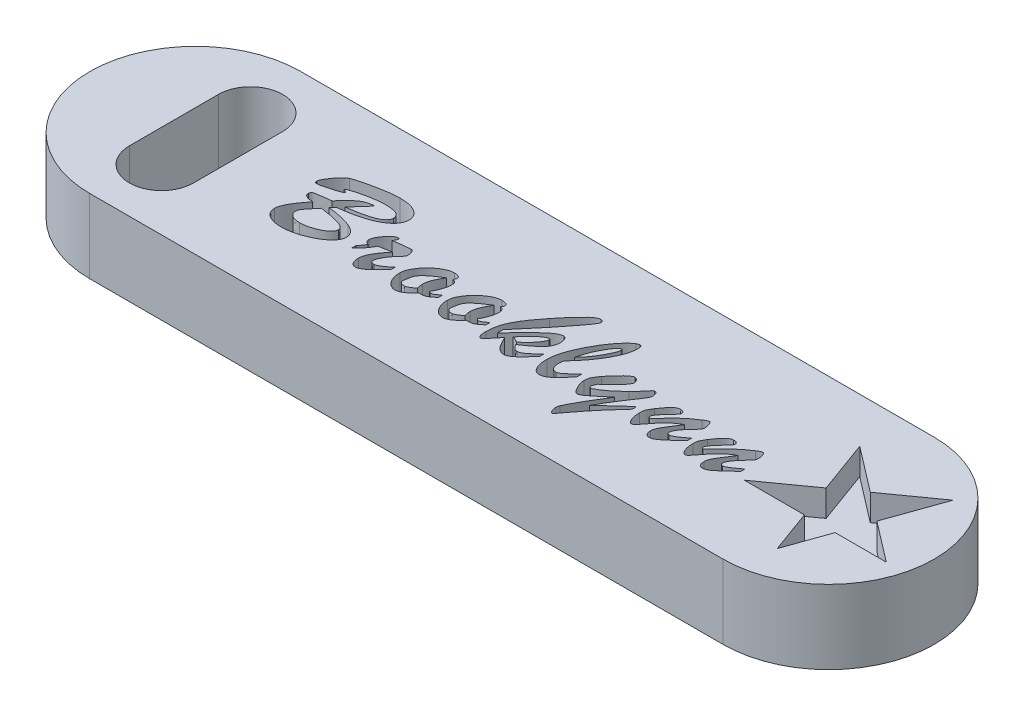
from build123d import *

# Parameters (mm, degrees)
BOSS_EXTRUDE1_DEPTH = 8.89
CUT_EXTRUDE1_DEPTH  = 38.1
CUT_EXTRUDE2_DEPTH  = 3.175
CUT_EXTRUDE3_DEPTH  = 3.175


with BuildPart() as part:
    # Sketch2 → Boss-Extrude1 (new body)
    with BuildSketch(Plane(origin=(0, 0, 0), x_dir=(1, 0, 0), z_dir=(0, 1, 0))):
        with BuildLine():
            Line((-42.129032778, 15.412364213), (34.070967222, 15.412364213))
            ThreePointArc((34.070967222, 15.412364213), (46.770967222, 2.712364213), (34.070967222, -9.987635787))
            Line((34.070967222, -9.987635787), (-42.129032778, -9.987635787))
            ThreePointArc((-42.129032778, -9.987635787), (-54.829032778, 2.712364213), (-42.129032778, 15.412364213))
        make_face()
    extrude(amount=BOSS_EXTRUDE1_DEPTH)

    # Sketch5 → Cut-Extrude1 (cut)
    with BuildSketch(Plane(origin=(0, 8.89, 0), x_dir=(1, 0, 0), z_dir=(0, 1, 0))):
        with BuildLine():
            Line((-36.974510492, 8.071411339), (-36.974510492, -2.646682912))
            ThreePointArc((-36.974510492, -2.646682912), (-40.840052681, -6.5122251), (-44.705594869, -2.646682912))
            Line((-44.705594869, -2.646682912), (-44.705594869, 8.071411339))
            ThreePointArc((-44.705594869, 8.071411339), (-40.840052681, 11.936953527), (-36.974510492, 8.071411339))
        make_face()
    extrude(amount=-CUT_EXTRUDE1_DEPTH, mode=Mode.SUBTRACT)

    # Sketch6 → Cut-Extrude2 (cut)
    # profile 1 of 10: a face of its own
    with BuildSketch(Plane(origin=(0, 8.89, 0), x_dir=(1, 0, 0), z_dir=(0, 1, 0))):
        Polygon((41.757850173, 9.988916722), (39.360587342, 3.220174612), (44.198771111, -0.488184187), (38.047210268, -0.488184187), (36.225096048, -5.632977277), (34.349390234, -0.488184187), (27.112324549, -0.488184187), (32.852313581, 3.618083205), (30.529613861, 9.988916722), (35.950141736, 5.834204293), align=None)
    # profile 2 of 10: a face of its own
    with BuildSketch(Plane(origin=(0, 8.89, 0), x_dir=(1, 0, 0), z_dir=(0, 1, 0))):
        with BuildLine():
            Line((-25.866186575, 3.392067536), (-26.245484411, 2.933381781))
            add(Edge.make_bspline(
                [(-26.245484411, 2.933381781), (-26.138093315, 2.922985077), (-25.928146151, 2.902659756), (-25.623135425, 2.862492606), (-25.335578275, 2.818743392), (-24.982097707, 2.754585912), (-24.569021542, 2.666697377), (-24.108634362, 2.544479687), (-23.692133887, 2.42187461), (-23.436910785, 2.321294905), (-23.316952284, 2.274021009)],
                knots=[0, 0, 0, 0, 0.859714041, 1.680721506, 2.451170941, 3.177326665, 4.543357982, 5.814947007, 6.972993905, 8, 8, 8, 8], degree=3))
            add(Edge.make_bspline(
                [(-23.316952284, 2.274021009), (-23.222635848, 2.232595579), (-23.042264596, 2.153373367), (-22.798640403, 2.009119201), (-22.590408469, 1.854282612), (-22.417810928, 1.687094141), (-22.285316551, 1.503825721), (-22.191863436, 1.308804364), (-22.130126586, 1.102368256), (-22.124550329, 0.95941683), (-22.121723057, 0.886937644)],
                knots=[0, 0, 0, 0, 1.267361107, 2.423708094, 3.47716118, 4.456306804, 5.370563359, 6.24488698, 7.11012317, 8, 8, 8, 8], degree=3))
            add(Edge.make_bspline(
                [(-22.121723057, 0.886937644), (-22.127889688, 0.796503758), (-22.140488161, 0.611746646), (-22.240434452, 0.339015361), (-22.401267433, 0.072727775), (-22.619249186, -0.186985484), (-22.883338139, -0.438853185), (-23.189704814, -0.675776791), (-23.530809667, -0.901615361), (-23.904069924, -1.109510126), (-24.297999977, -1.299286518), (-24.702514633, -1.468880666), (-25.111730057, -1.619644976), (-25.523442063, -1.744441582), (-25.927938565, -1.84221987), (-26.316809156, -1.917387673), (-26.687775989, -1.960153748), (-26.929007693, -1.96747663), (-27.045979262, -1.971027444)],
                knots=[0, 0, 0, 0, 0.712564817, 1.455775292, 2.264839529, 3.1593648, 4.123803986, 5.140636607, 6.212472301, 7.35039145, 8.510464522, 9.662513643, 10.811665701, 11.951595153, 13.056380002, 14.095436893, 15.076490644, 16, 16, 16, 16], degree=3))
            add(Edge.make_bspline(
                [(-27.045979262, -1.971027444), (-27.138650357, -1.969943411), (-27.318336075, -1.967841512), (-27.580158627, -1.946282624), (-27.826727383, -1.918199212), (-28.056682268, -1.869958529), (-28.272238602, -1.814749432), (-28.470485495, -1.740587201), (-28.655101715, -1.657728752), (-28.822364403, -1.560370574), (-28.973457589, -1.453834042), (-29.10182964, -1.332582839), (-29.214016922, -1.204682627), (-29.304546879, -1.065775521), (-29.373665836, -0.916931052), (-29.425374374, -0.7603454), (-29.453573027, -0.592293114), (-29.458280555, -0.477455141), (-29.460695135, -0.418552581)],
                knots=[0, 0, 0, 0, 1.383710309, 2.682961499, 3.922146879, 5.086977825, 6.189505547, 7.241917307, 8.244112367, 9.208241214, 10.128425328, 10.99844964, 11.839164159, 12.664395647, 13.464939076, 14.284307388, 15.119988935, 16, 16, 16, 16], degree=3))
            add(Edge.make_bspline(
                [(-29.460695135, -0.418552581), (-29.455681869, -0.327679655), (-29.44505633, -0.135075881), (-29.362379152, 0.161132121), (-29.240909034, 0.480820999), (-29.098460369, 0.757011637), (-28.959600069, 0.991587518), (-28.841768615, 1.185037484), (-28.708437546, 1.388079504), (-28.562816221, 1.601973466), (-28.404543386, 1.826589606), (-28.231167539, 2.0614034), (-28.044885904, 2.306715027), (-27.915017933, 2.473366299), (-27.848679333, 2.558494385)],
                knots=[0, 0, 0, 0, 0.951263667, 2.016188748, 3.203592303, 4.533354919, 5.265271798, 6.060596717, 6.90667715, 7.810439189, 8.772186954, 9.785958112, 10.86903263, 12, 12, 12, 12], degree=3))
            add(Edge.make_bspline(
                [(-27.848679333, 2.558494385), (-27.945164135, 2.564005605), (-28.123506093, 2.574192512), (-28.366853961, 2.614257413), (-28.566403846, 2.664489354), (-28.723453556, 2.732177673), (-28.842847988, 2.818019026), (-28.923988877, 2.922737306), (-28.977060499, 3.041926399), (-28.981890902, 3.127611676), (-28.98436762, 3.171545538)],
                knots=[0, 0, 0, 0, 1.620598631, 2.995505281, 4.132544123, 5.065618832, 5.850134739, 6.570656336, 7.267125107, 8, 8, 8, 8], degree=3))
            add(Edge.make_bspline(
                [(-28.98436762, 3.171545538), (-28.981097515, 3.223634533), (-28.975023594, 3.32038508), (-28.892101012, 3.442853345), (-28.769187672, 3.519013438), (-28.642673601, 3.562219822), (-28.510696311, 3.589291116), (-28.370832066, 3.612688249), (-28.192927651, 3.639246846), (-27.978219296, 3.667580625), (-27.727150941, 3.696683977), (-27.442573249, 3.737004446), (-27.123631816, 3.771400729), (-26.900381079, 3.800331061), (-26.783558085, 3.815469771)],
                knots=[0, 0, 0, 0, 0.757676578, 1.407315001, 2.087028647, 2.858775201, 3.369244765, 4.073429773, 4.950645925, 6.02265614, 7.268146286, 8.67910223, 10.262235425, 12, 12, 12, 12], degree=3))
            add(Edge.make_bspline(
                [(-26.783558085, 3.815469771), (-26.653406456, 3.968166181), (-26.405523154, 4.258987667), (-26.030275611, 4.653581455), (-25.678667743, 4.99135659), (-25.342027169, 5.271248092), (-25.008026039, 5.49695384), (-24.664590613, 5.664896902), (-24.309532867, 5.785175102), (-24.06535157, 5.818690152), (-23.943234757, 5.835451269)],
                knots=[0, 0, 0, 0, 1.346005217, 2.56356542, 3.652039199, 4.615727429, 5.498043554, 6.349477723, 7.174562001, 8, 8, 8, 8], degree=3))
            add(Edge.make_bspline(
                [(-23.943234757, 5.835451269), (-23.922473189, 5.838076991), (-23.878844521, 5.843594723), (-23.820633425, 5.843519911), (-23.75984725, 5.846536965), (-23.747369869, 5.81784456), (-23.742559739, 5.806783409)],
                knots=[0, 0, 0, 0, 1.140417194, 2.39648967, 3.381833987, 4, 4, 4, 4], degree=3))
            add(Edge.make_bspline(
                [(-23.742559739, 5.806783409), (-23.745743314, 5.795528438), (-23.754177375, 5.765711294), (-23.790908341, 5.716841815), (-23.841138176, 5.647367568), (-23.917716214, 5.559974659), (-24.015572461, 5.448458745), (-24.139333715, 5.310363936), (-24.286735534, 5.141170873), (-24.462314355, 4.94824287), (-24.656824686, 4.728282971), (-24.870305636, 4.488924488), (-25.10087067, 4.229223052), (-25.260464734, 4.049939111), (-25.343549441, 3.95660385)],
                knots=[0, 0, 0, 0, 0.170753535, 0.45236748, 0.884343552, 1.43606511, 2.155340943, 3.06563507, 4.159790895, 5.45215942, 6.897868204, 8.473618983, 10.16416522, 12, 12, 12, 12], degree=3))
            add(Edge.make_bspline(
                [(-25.343549441, 3.95660385), (-25.121414198, 3.987980143), (-24.698489139, 4.047717719), (-24.096498364, 4.14808441), (-23.558764707, 4.257631034), (-23.081729763, 4.37414096), (-22.662128783, 4.497548437), (-22.29987373, 4.636565075), (-21.989250879, 4.782564749), (-21.733286357, 4.942614243), (-21.530492048, 5.113999225), (-21.384115226, 5.297113437), (-21.292437813, 5.49314937), (-21.280692982, 5.629489986), (-21.274918587, 5.69652241)],
                knots=[0, 0, 0, 0, 1.724846668, 3.283949303, 4.691630375, 5.943130907, 7.058831284, 8.051754163, 8.923845706, 9.693686913, 10.366790242, 10.954680153, 11.486064197, 12, 12, 12, 12], degree=3))
            add(Edge.make_bspline(
                [(-21.274918587, 5.69652241), (-21.275755523, 5.736361906), (-21.27739983, 5.814633577), (-21.302960347, 5.926567186), (-21.340680399, 6.030793977), (-21.393856083, 6.126476288), (-21.463373531, 6.212537531), (-21.546175072, 6.291850145), (-21.646230832, 6.359014629), (-21.760399562, 6.41871408), (-21.889134389, 6.472576905), (-22.035556253, 6.514347329), (-22.196097628, 6.55548783), (-22.373273048, 6.584923603), (-22.565993535, 6.60919903), (-22.774899885, 6.627122041), (-23.000084568, 6.634550489), (-23.155234071, 6.636925034), (-23.235359145, 6.638151339)],
                knots=[0, 0, 0, 0, 0.786734665, 1.545678105, 2.259061328, 2.97540466, 3.700117973, 4.44100218, 5.235898072, 6.075333835, 6.988423574, 7.991620688, 9.085337389, 10.266761078, 11.542402229, 12.929232788, 14.414139638, 16, 16, 16, 16], degree=3))
            add(Edge.make_bspline(
                [(-23.235359145, 6.638151339), (-23.330226116, 6.636968858), (-23.526817281, 6.634518421), (-23.83200007, 6.610192593), (-24.157092067, 6.575373986), (-24.495945847, 6.526996877), (-24.835913536, 6.469408091), (-25.16671912, 6.412035078), (-25.479385188, 6.344487775), (-25.865098484, 6.256165544), (-26.307263203, 6.137848834), (-26.713507663, 6.010263145), (-26.985169916, 5.908026425), (-27.124414389, 5.846757119), (-27.218377925, 5.799160698), (-27.244493834, 5.755349364), (-27.25326994, 5.74062681)],
                knots=[0, 0, 0, 0, 0.95815754, 1.985573115, 3.090960949, 4.260812328, 5.442504965, 6.574240779, 7.651946592, 8.673252712, 10.571717014, 12.271896923, 12.979355426, 13.491289114, 13.829050538, 14, 14, 14, 14], degree=3))
            add(Edge.make_bspline(
                [(-27.25326994, 5.74062681), (-27.250207349, 5.732718887), (-27.241976326, 5.71146554), (-27.22046668, 5.702286268), (-27.20696032, 5.69652241)],
                knots=[0, 0, 0, 0, 0.744157845, 2, 2, 2, 2], degree=3))
            add(Edge.make_bspline(
                [(-27.20696032, 5.69652241), (-27.153401443, 5.676082307), (-27.05972715, 5.640332636), (-26.946495081, 5.583886476), (-26.865912684, 5.536145749), (-26.849289075, 5.4923197), (-26.843099024, 5.476000413)],
                knots=[0, 0, 0, 0, 1.566337202, 2.739518381, 3.530640762, 4, 4, 4, 4], degree=3))
            add(Edge.make_bspline(
                [(-26.843099024, 5.476000413), (-26.848221168, 5.464351852), (-26.862382387, 5.432147007), (-26.924264682, 5.396979707), (-27.010981717, 5.350260619), (-27.136644484, 5.2992553), (-27.293662441, 5.236899499), (-27.488163935, 5.17204689), (-27.715947218, 5.095994852), (-27.972156215, 5.021667644), (-28.232029746, 4.942830939), (-28.480358883, 4.879366432), (-28.702449074, 4.816514036), (-28.904001365, 4.77229947), (-29.081892065, 4.731755094), (-29.238615658, 4.710524663), (-29.370445985, 4.688787949), (-29.451072116, 4.687229274), (-29.487157775, 4.686531661)],
                knots=[0, 0, 0, 0, 0.215306707, 0.595259719, 1.167436381, 1.939072629, 2.917487498, 4.083020845, 5.468793512, 7.055523875, 8.678683854, 10.147180263, 11.47127396, 12.654088564, 13.702312139, 14.612262365, 15.378893352, 16, 16, 16, 16], degree=3))
            add(Edge.make_bspline(
                [(-29.487157775, 4.686531661), (-29.528328528, 4.689041794), (-29.603038798, 4.693596791), (-29.701016643, 4.748633906), (-29.758063035, 4.845057608), (-29.762566463, 4.919497476), (-29.765015491, 4.959978938)],
                knots=[0, 0, 0, 0, 1.104736656, 2.004703978, 2.914929535, 4, 4, 4, 4], degree=3))
            add(Edge.make_bspline(
                [(-29.765015491, 4.959978938), (-29.763082765, 4.989549923), (-29.758759136, 5.055702042), (-29.726575068, 5.160986555), (-29.679956629, 5.283448838), (-29.613074405, 5.421849557), (-29.52631779, 5.575609591), (-29.421689337, 5.745659832), (-29.300988407, 5.933345566), (-29.163276093, 6.12980133), (-29.019506659, 6.326215196), (-28.874861556, 6.509539983), (-28.730839966, 6.672530169), (-28.592715271, 6.818353677), (-28.458321915, 6.945712605), (-28.325158193, 7.05088774), (-28.198073313, 7.141955734), (-28.109472793, 7.187478757), (-28.066996111, 7.209303313)],
                knots=[0, 0, 0, 0, 0.492233188, 1.101156038, 1.822038554, 2.676455987, 3.657642451, 4.762252669, 6.001939952, 7.374227217, 8.757939073, 10.056403163, 11.262434148, 12.379663494, 13.401935816, 14.342792312, 15.20550483, 16, 16, 16, 16], degree=3))
            add(Edge.make_bspline(
                [(-28.066996111, 7.209303313), (-28.028913514, 7.225110941), (-27.934779654, 7.264184776), (-27.762800972, 7.321566198), (-27.534303239, 7.392638987), (-27.143349074, 7.50216753), (-26.58954669, 7.650649601), (-25.875802309, 7.812448362), (-25.126285556, 7.962005485), (-24.489967004, 8.0643669), (-23.987962718, 8.129874469), (-23.632842216, 8.165599472), (-23.299563551, 8.186370876), (-23.085430195, 8.189238068), (-22.981758848, 8.190626202)],
                knots=[0, 0, 0, 0, 0.285515603, 0.705747212, 1.254864839, 1.943005008, 3.51750929, 5.225556965, 7.010816859, 8.810371585, 9.688141018, 10.516927118, 11.281979385, 12, 12, 12, 12], degree=3))
            add(Edge.make_bspline(
                [(-22.981758848, 8.190626202), (-22.867021727, 8.189938246), (-22.645351256, 8.188609125), (-22.323963649, 8.161961021), (-22.024324274, 8.127738699), (-21.747314518, 8.070315628), (-21.490777829, 8.00526054), (-21.258221764, 7.916711145), (-21.044699952, 7.820239714), (-20.857066139, 7.701754629), (-20.691686676, 7.573087913), (-20.54495524, 7.439924102), (-20.421501233, 7.296143544), (-20.319628674, 7.144909343), (-20.241848694, 6.98424248), (-20.18600715, 6.816840455), (-20.151899482, 6.64100533), (-20.147886203, 6.520692382), (-20.14584596, 6.459528521)],
                knots=[0, 0, 0, 0, 1.486941531, 2.872749697, 4.178904351, 5.393734845, 6.537999416, 7.605434921, 8.61583059, 9.570440747, 10.473975148, 11.330448872, 12.134640403, 12.924934093, 13.687863119, 14.441269008, 15.207583172, 16, 16, 16, 16], degree=3))
            add(Edge.make_bspline(
                [(-20.14584596, 6.459528521), (-20.149472809, 6.376064104), (-20.156762317, 6.208311189), (-20.222866308, 5.960833952), (-20.324962162, 5.717519896), (-20.471430656, 5.480277156), (-20.657592241, 5.247321165), (-20.891386759, 5.023899703), (-21.168342257, 4.805549071), (-21.491997882, 4.59485474), (-21.861644538, 4.389607284), (-22.286616547, 4.205391355), (-22.759674523, 4.02591618), (-23.286002945, 3.864592633), (-23.860407893, 3.716691082), (-24.485793787, 3.590795648), (-25.15844891, 3.477041619), (-25.625537896, 3.42096087), (-25.866186575, 3.392067536)],
                knots=[0, 0, 0, 0, 0.573790395, 1.153246073, 1.752097641, 2.385809204, 3.066442096, 3.800257919, 4.607382793, 5.491845115, 6.456944054, 7.515154979, 8.678105096, 9.93969276, 11.303647403, 12.760942623, 14.33120689, 16, 16, 16, 16], degree=3))
        make_face()
        with BuildLine():
            add(Edge.make_bspline(
                [(-26.655655326, 2.404128987), (-26.719039946, 2.32781947), (-26.841842745, 2.179975683), (-27.017933136, 1.962389999), (-27.185771413, 1.760304129), (-27.341292975, 1.571760544), (-27.482012117, 1.400940382), (-27.599581071, 1.243916731), (-27.699596916, 1.107474677), (-27.797658577, 0.949637264), (-27.887969451, 0.760047554), (-27.901596276, 0.600589079), (-27.908220272, 0.523076348)],
                knots=[0, 0, 0, 0, 1.297580472, 2.513961818, 3.661350271, 4.733642842, 5.71122381, 6.555441607, 7.299854436, 7.921575475, 8.989678291, 10, 10, 10, 10], degree=3))
            add(Edge.make_bspline(
                [(-27.908220272, 0.523076348), (-27.904319699, 0.462793075), (-27.896433973, 0.340919373), (-27.8192278, 0.167446324), (-27.701243279, 0.005509063), (-27.538263389, -0.141802553), (-27.33241424, -0.269569709), (-27.080397668, -0.353823765), (-26.792019175, -0.411139502), (-26.586154904, -0.415984431), (-26.477032508, -0.418552581)],
                knots=[0, 0, 0, 0, 0.758747806, 1.533947953, 2.359626846, 3.280795701, 4.29485818, 5.400498468, 6.622083211, 8, 8, 8, 8], degree=3))
            add(Edge.make_bspline(
                [(-26.477032508, -0.418552581), (-26.368105458, -0.415295726), (-26.145740192, -0.408647136), (-25.808036766, -0.362335755), (-25.460378355, -0.288853556), (-25.108762081, -0.189002479), (-24.76548699, -0.06505536), (-24.443426372, 0.076029483), (-24.151985937, 0.239187261), (-23.893177558, 0.412942611), (-23.676255438, 0.596695564), (-23.515432454, 0.78595809), (-23.411906528, 0.981184675), (-23.39837716, 1.115990439), (-23.391929763, 1.180231901)],
                knots=[0, 0, 0, 0, 1.06016049, 2.164227044, 3.312148238, 4.517122552, 5.718969904, 6.862489535, 7.935538164, 8.965545957, 9.893772176, 10.691734697, 11.376548354, 12, 12, 12, 12], degree=3))
            add(Edge.make_bspline(
                [(-23.391929763, 1.180231901), (-23.395930406, 1.233205878), (-23.403949164, 1.339385172), (-23.478576518, 1.488550049), (-23.599044991, 1.618980744), (-23.764727908, 1.732810368), (-23.974712661, 1.835198892), (-24.228831009, 1.934493669), (-24.532285217, 2.021934967), (-24.879666251, 2.107207609), (-25.269670968, 2.187912745), (-25.698489581, 2.264312731), (-26.164784421, 2.336775579), (-26.487985081, 2.381122607), (-26.655655326, 2.404128987)],
                knots=[0, 0, 0, 0, 0.516012619, 1.034278689, 1.594886709, 2.239910011, 2.989823973, 3.878557251, 4.907717911, 6.078932596, 7.380291583, 8.806084166, 10.343058292, 12, 12, 12, 12], degree=3))
        make_face(mode=Mode.SUBTRACT)
    # profile 3 of 10: a face of its own
    with BuildSketch(Plane(origin=(0, 8.89, 0), x_dir=(1, 0, 0), z_dir=(0, 1, 0))):
        with BuildLine():
            Line((-20.679509194, 0.057774933), (-20.679509194, 0.584822508))
            add(Edge.make_bspline(
                [(-20.679509194, 0.584822508), (-20.615695263, 0.665226068), (-20.49465786, 0.81772942), (-20.331224308, 1.042237976), (-20.189215155, 1.245695835), (-20.10709676, 1.3783584), (-20.06866326, 1.440447858)],
                knots=[0, 0, 0, 0, 1.170756816, 2.220602377, 3.167196615, 4, 4, 4, 4], degree=3))
            add(Edge.make_bspline(
                [(-20.06866326, 1.440447858), (-20.105601561, 1.454674174), (-20.175364174, 1.481542355), (-20.271988321, 1.527087976), (-20.351512384, 1.579723931), (-20.416495485, 1.638094505), (-20.465560198, 1.70879757), (-20.499946356, 1.792114517), (-20.519935056, 1.890865545), (-20.521888365, 1.960779019), (-20.522938575, 1.998368512)],
                knots=[0, 0, 0, 0, 1.209969933, 2.285179997, 3.2573193, 4.115842444, 4.93863427, 5.865037457, 6.852121733, 8, 8, 8, 8], degree=3))
            add(Edge.make_bspline(
                [(-20.522938575, 1.998368512), (-20.52020313, 2.046406672), (-20.514347192, 2.149244935), (-20.467460397, 2.310409235), (-20.396595231, 2.487873149), (-20.26451052, 2.749117326), (-20.054286498, 3.074776776), (-19.807875825, 3.379026205), (-19.597107318, 3.595040997), (-19.444006801, 3.726744317), (-19.298927126, 3.829760887), (-19.19834412, 3.875613311), (-19.151291751, 3.89706291)],
                knots=[0, 0, 0, 0, 0.594697849, 1.273106498, 2.066554359, 2.962905714, 4.896321801, 6.858459045, 7.805465603, 8.632563479, 9.360318103, 10, 10, 10, 10], degree=3))
            add(Edge.make_bspline(
                [(-19.151291751, 3.89706291), (-19.116554915, 3.912487884), (-19.050384149, 3.94187117), (-18.978262111, 3.947374075), (-18.944001073, 3.94998819)],
                knots=[0, 0, 0, 0, 1.049914848, 2, 2, 2, 2], degree=3))
            add(Edge.make_bspline(
                [(-18.944001073, 3.94998819), (-18.920883939, 3.948830686), (-18.879232918, 3.946745168), (-18.824513208, 3.919060134), (-18.792473381, 3.868717709), (-18.790633688, 3.829907961), (-18.789635675, 3.808854111)],
                knots=[0, 0, 0, 0, 1.152810748, 2.077063083, 2.956828464, 4, 4, 4, 4], degree=3))
            add(Edge.make_bspline(
                [(-18.789635675, 3.808854111), (-18.793833672, 3.782129484), (-18.804195915, 3.716163005), (-18.854308547, 3.605411541), (-18.92960781, 3.462655957), (-18.992612831, 3.357933152), (-19.027799432, 3.299448297)],
                knots=[0, 0, 0, 0, 0.57154836, 1.410797375, 2.554000326, 4, 4, 4, 4], degree=3))
            add(Edge.make_bspline(
                [(-19.027799432, 3.299448297), (-18.903631435, 3.318243123), (-18.667218549, 3.35402802), (-18.330080552, 3.398455296), (-18.029871031, 3.442075585), (-17.765223654, 3.475357576), (-17.536466131, 3.499272568), (-17.343895832, 3.517237325), (-17.188047756, 3.529200417), (-17.096039832, 3.531995406), (-17.056332774, 3.533201614)],
                knots=[0, 0, 0, 0, 1.517409458, 2.889111197, 4.108807755, 5.182954051, 6.111844727, 6.887847242, 7.520037924, 8, 8, 8, 8], degree=3))
            add(Edge.make_bspline(
                [(-17.056332774, 3.533201614), (-17.011085703, 3.533692), (-16.936010396, 3.534505662), (-16.8643015, 3.513055956), (-16.835810777, 3.504533755)],
                knots=[0, 0, 0, 0, 1.205378257, 2, 2, 2, 2], degree=3))
            add(Edge.make_bspline(
                [(-16.835810777, 3.504533755), (-16.815168154, 3.490744463), (-16.770534283, 3.460928995), (-16.716026024, 3.3915462), (-16.668136421, 3.301482593), (-16.611587439, 3.156063346), (-16.558127829, 2.958187259), (-16.550636258, 2.794102831), (-16.54692696, 2.712859784)],
                knots=[0, 0, 0, 0, 0.510310252, 1.103402495, 1.796726408, 2.614600255, 4.323788586, 6, 6, 6, 6], degree=3))
            add(Edge.make_bspline(
                [(-16.54692696, 2.712859784), (-16.548923473, 2.686251502), (-16.553047627, 2.631287346), (-16.578746075, 2.547082812), (-16.624343524, 2.46218107), (-16.686255012, 2.370388835), (-16.772285011, 2.270782874), (-16.874750344, 2.147928077), (-17.005804964, 2.008160041), (-17.101780844, 1.908559092), (-17.153362453, 1.855029213)],
                knots=[0, 0, 0, 0, 0.596607742, 1.232399805, 1.954314114, 2.749203525, 3.708776231, 4.900399092, 6.334139783, 8, 8, 8, 8], degree=3))
            add(Edge.make_bspline(
                [(-17.153362453, 1.855029213), (-17.218287574, 1.779367161), (-17.347568527, 1.628706491), (-17.523546242, 1.389473376), (-17.685700267, 1.141857298), (-17.827168876, 0.890347655), (-17.944409084, 0.650398678), (-18.028693239, 0.435897147), (-18.085542867, 0.253936209), (-18.095129433, 0.141127877), (-18.099401823, 0.090853233)],
                knots=[0, 0, 0, 0, 1.1788436, 2.347350646, 3.509663661, 4.677556017, 5.75856454, 6.664295628, 7.404724272, 8, 8, 8, 8], degree=3))
            add(Edge.make_bspline(
                [(-18.099401823, 0.090853233), (-18.098237317, 0.062080263), (-18.09602573, 0.007435662), (-18.076546262, -0.069928154), (-18.040751615, -0.134541083), (-17.991732123, -0.188253248), (-17.929312355, -0.230316118), (-17.852292848, -0.258935695), (-17.762506013, -0.272954436), (-17.698828267, -0.275868968), (-17.664973487, -0.277418503)],
                knots=[0, 0, 0, 0, 1.058970927, 2.011159953, 2.907848527, 3.751036084, 4.667132249, 5.652608723, 6.751990794, 8, 8, 8, 8], degree=3))
            add(Edge.make_bspline(
                [(-17.664973487, -0.277418503), (-17.622755915, -0.273893993), (-17.529622516, -0.266118803), (-17.383622901, -0.214240616), (-17.21659909, -0.137817711), (-17.028145981, -0.032065525), (-16.820299496, 0.107841616), (-16.589275957, 0.274526487), (-16.338706631, 0.47368988), (-16.167218804, 0.618881246), (-16.077215105, 0.695083506)],
                knots=[0, 0, 0, 0, 0.537074028, 1.18480354, 1.954918745, 2.875993105, 3.929090292, 5.141296187, 6.49963742, 8, 8, 8, 8], degree=3))
            Line((-16.077215105, 0.695083506), (-16.077215105, 0.170241152))
            add(Edge.make_bspline(
                [(-16.077215105, 0.170241152), (-16.177009782, 0.066427851), (-16.36613967, -0.130318094), (-16.637927143, -0.407679329), (-16.884133892, -0.648872194), (-17.10455411, -0.860153947), (-17.308379171, -1.041744884), (-17.50104215, -1.201420852), (-17.685633712, -1.343113745), (-17.862561072, -1.463916805), (-18.030226433, -1.562999782), (-18.189334922, -1.634844238), (-18.340912553, -1.680560743), (-18.440202905, -1.686113212), (-18.487520538, -1.688759287)],
                knots=[0, 0, 0, 0, 1.673728622, 3.172033995, 4.51326978, 5.679642986, 6.720511198, 7.685352113, 8.58760008, 9.424104508, 10.174401219, 10.8475722, 11.450801063, 12, 12, 12, 12], degree=3))
            add(Edge.make_bspline(
                [(-18.487520538, -1.688759287), (-18.538774859, -1.685693517), (-18.640041535, -1.679636265), (-18.784066967, -1.620483597), (-18.911570055, -1.524251071), (-19.025880631, -1.393993809), (-19.117406994, -1.227048687), (-19.183241871, -1.026129576), (-19.221889929, -0.793445653), (-19.226199288, -0.627468643), (-19.22847445, -0.53983968)],
                knots=[0, 0, 0, 0, 0.804380352, 1.589269438, 2.409170875, 3.303542514, 4.298960831, 5.38656711, 6.620216058, 8, 8, 8, 8], degree=3))
            add(Edge.make_bspline(
                [(-19.22847445, -0.53983968), (-19.225964632, -0.483130422), (-19.220716975, -0.364559801), (-19.188696692, -0.181882731), (-19.134406746, 0.011892485), (-19.0583815, 0.216159866), (-18.964138511, 0.432662728), (-18.845590106, 0.656407084), (-18.711404355, 0.89104354), (-18.501960553, 1.217383544), (-18.208878297, 1.630964561), (-17.949145707, 1.949125709), (-17.817133666, 2.11083473)],
                knots=[0, 0, 0, 0, 0.557581478, 1.165819901, 1.817972858, 2.533502653, 3.306830331, 4.137454648, 5.021198022, 5.963366097, 7.948334925, 10, 10, 10, 10], degree=3))
            add(Edge.make_bspline(
                [(-17.817133666, 2.11083473), (-17.892105666, 2.096107716), (-18.051529619, 2.064791508), (-18.30190633, 2.016176071), (-18.574235475, 1.968816286), (-18.808066294, 1.928118145), (-18.990849865, 1.895047027), (-19.113388366, 1.876700702), (-19.21802993, 1.8556473), (-19.282846141, 1.844605616), (-19.312272809, 1.839592673)],
                knots=[0, 0, 0, 0, 1.206707352, 2.56599872, 4.028045479, 5.572138952, 6.314595984, 6.961605096, 7.528566979, 8, 8, 8, 8], degree=3))
            add(Edge.make_bspline(
                [(-19.312272809, 1.839592673), (-19.396299515, 1.678035463), (-19.565746166, 1.352242278), (-19.886691078, 0.895742754), (-20.25468934, 0.457453422), (-20.5362877, 0.192520402), (-20.679509194, 0.057774933)],
                knots=[0, 0, 0, 0, 0.966144468, 1.948308485, 2.956505555, 4, 4, 4, 4], degree=3))
        make_face()
    # profile 4 of 10: a face of its own
    with BuildSketch(Plane(origin=(0, 8.89, 0), x_dir=(1, 0, 0), z_dir=(0, 1, 0))):
        with BuildLine():
            Line((-10.31718053, 0.639953007), (-10.31718053, 0.148188952))
            add(Edge.make_bspline(
                [(-10.31718053, 0.148188952), (-10.395898719, 0.079764711), (-10.542648723, -0.047794851), (-10.756193795, -0.213433684), (-10.944715395, -0.343409895), (-11.116343323, -0.444011155), (-11.2966887, -0.509980198), (-11.500592426, -0.546839293), (-11.73625056, -0.567445763), (-11.904172806, -0.560932528), (-11.993147711, -0.55748144)],
                knots=[0, 0, 0, 0, 1.326692709, 2.473280475, 3.435551712, 4.239379219, 4.996773376, 5.864225407, 6.868343249, 8, 8, 8, 8], degree=3))
            add(Edge.make_bspline(
                [(-11.993147711, -0.55748144), (-12.0715926, -0.646558267), (-12.221502334, -0.816785844), (-12.452052981, -1.048021218), (-12.675208576, -1.2444195), (-12.892338297, -1.405448198), (-13.102032101, -1.530320103), (-13.304963298, -1.621015985), (-13.502159457, -1.677411287), (-13.632773122, -1.6850745), (-13.695577532, -1.688759287)],
                knots=[0, 0, 0, 0, 1.355624993, 2.590626168, 3.727313514, 4.748426394, 5.67441081, 6.509089803, 7.283109197, 8, 8, 8, 8], degree=3))
            add(Edge.make_bspline(
                [(-13.695577532, -1.688759287), (-13.763502123, -1.685184775), (-13.899039962, -1.678052135), (-14.097351377, -1.625944194), (-14.28591692, -1.538035375), (-14.461208138, -1.415122317), (-14.625386777, -1.26595266), (-14.768014416, -1.085479395), (-14.899453164, -0.885429996), (-15.009221114, -0.65930773), (-15.09619841, -0.413569076), (-15.160646418, -0.152223568), (-15.19830104, 0.122835692), (-15.203502016, 0.310525001), (-15.206153215, 0.40619969)],
                knots=[0, 0, 0, 0, 0.855509558, 1.707097737, 2.565061559, 3.464438916, 4.395465232, 5.350382483, 6.355095104, 7.407452959, 8.509213956, 9.63490185, 10.794390414, 12, 12, 12, 12], degree=3))
            add(Edge.make_bspline(
                [(-15.206153215, 0.40619969), (-15.201987004, 0.488106238), (-15.193292247, 0.659042717), (-15.129656303, 0.919904998), (-15.028888196, 1.193089379), (-14.889374594, 1.473678025), (-14.721944154, 1.757165929), (-14.526387507, 2.033723343), (-14.308051075, 2.300283139), (-14.068330564, 2.554918331), (-13.813873504, 2.79267289), (-13.546965608, 3.008398397), (-13.272603, 3.200198868), (-12.990822191, 3.365127529), (-12.711584395, 3.501483107), (-12.437766411, 3.600741836), (-12.17368667, 3.661291591), (-12.000045714, 3.670080105), (-11.915965012, 3.674335693)],
                knots=[0, 0, 0, 0, 0.791499778, 1.651836002, 2.582703007, 3.603040698, 4.676902459, 5.76339062, 6.874542189, 8.005854543, 9.142356788, 10.239025647, 11.321438051, 12.375837303, 13.393076106, 14.321525165, 15.187246224, 16, 16, 16, 16], degree=3))
            add(Edge.make_bspline(
                [(-11.915965012, 3.674335693), (-11.860051195, 3.673150331), (-11.754440907, 3.670911415), (-11.605332721, 3.65224811), (-11.475601326, 3.616708943), (-11.365083299, 3.569220957), (-11.274569492, 3.510098056), (-11.20731072, 3.438387086), (-11.167115133, 3.352326227), (-11.162122271, 3.291031315), (-11.159574561, 3.259754337)],
                knots=[0, 0, 0, 0, 1.405108728, 2.653976187, 3.76548404, 4.774638535, 5.666182971, 6.46398965, 7.216219413, 8, 8, 8, 8], degree=3))
            add(Edge.make_bspline(
                [(-11.159574561, 3.259754337), (-11.161995442, 3.233733038), (-11.167213671, 3.177643904), (-11.204224079, 3.092885875), (-11.259439748, 3.002086255), (-11.309282729, 2.944430743), (-11.335992159, 2.913534801)],
                knots=[0, 0, 0, 0, 0.787103102, 1.696607463, 2.765677774, 4, 4, 4, 4], degree=3))
            add(Edge.make_bspline(
                [(-11.335992159, 2.913534801), (-11.290824964, 2.902907412), (-11.207088242, 2.883204999), (-11.094310112, 2.839146321), (-11.003632511, 2.784878464), (-10.934543842, 2.714531157), (-10.886748729, 2.623421524), (-10.852082899, 2.509316026), (-10.834205421, 2.366447201), (-10.832127099, 2.262300402), (-10.830996784, 2.205659189)],
                knots=[0, 0, 0, 0, 1.135342827, 2.104843743, 2.954052047, 3.705239993, 4.486876621, 5.449163014, 6.612703401, 8, 8, 8, 8], degree=3))
            add(Edge.make_bspline(
                [(-10.830996784, 2.205659189), (-10.83361581, 2.141625344), (-10.839210044, 2.00484915), (-10.871310488, 1.78770602), (-10.928885916, 1.547751943), (-11.001220607, 1.287856498), (-11.094788877, 1.022262797), (-11.203716262, 0.759116502), (-11.327699951, 0.504230896), (-11.424517491, 0.341611409), (-11.472715797, 0.260655171)],
                knots=[0, 0, 0, 0, 0.743119266, 1.587301605, 2.540937163, 3.604522133, 4.715656266, 5.805212925, 6.907377541, 8, 8, 8, 8], degree=3))
            Line((-11.472715797, 0.260655171), (-11.335992159, 0.126136753))
            Line((-11.335992159, 0.126136753), (-11.22352594, 0.126136753))
            add(Edge.make_bspline(
                [(-11.22352594, 0.126136753), (-11.180458927, 0.129135086), (-11.092611328, 0.135251053), (-10.96803046, 0.184991522), (-10.855399013, 0.251362063), (-10.761264528, 0.313082909), (-10.674796057, 0.37630424), (-10.582433432, 0.446008523), (-10.458461138, 0.534771076), (-10.367771466, 0.602288586), (-10.31718053, 0.639953007)],
                knots=[0, 0, 0, 0, 0.974523146, 1.987821175, 3.003724616, 3.942915018, 4.54018134, 5.434293142, 6.568728837, 8, 8, 8, 8], degree=3))
        make_face()
        with BuildLine():
            add(Edge.make_bspline(
                [(-11.878476272, 2.686397144), (-11.975846116, 2.625172551), (-12.164350244, 2.506644183), (-12.432058606, 2.326326361), (-12.682393512, 2.161028416), (-12.97489295, 1.950428528), (-13.302808849, 1.698746814), (-13.589836673, 1.431992149), (-13.778672513, 1.214750798), (-13.893193776, 1.055779363), (-13.980314286, 0.893560333), (-14.021662975, 0.782325739), (-14.041797068, 0.728161806)],
                knots=[0, 0, 0, 0, 1.162679127, 2.250900356, 3.262870239, 4.194964729, 5.894092788, 7.439515267, 8.145588819, 8.801256047, 9.416290514, 10, 10, 10, 10], degree=3))
            add(Edge.make_bspline(
                [(-14.041797068, 0.728161806), (-14.056022595, 0.661322393), (-14.082882616, 0.535119118), (-14.116633248, 0.357511219), (-14.148952503, 0.205042447), (-14.172122438, 0.076795736), (-14.193032616, -0.025805638), (-14.205478902, -0.104687483), (-14.215870858, -0.158092568), (-14.217620063, -0.186252886), (-14.218214666, -0.195825364)],
                knots=[0, 0, 0, 0, 1.742956137, 3.290974022, 4.611019174, 5.717848655, 6.615064775, 7.280854166, 7.755542263, 8, 8, 8, 8], degree=3))
            add(Edge.make_bspline(
                [(-14.218214666, -0.195825364), (-14.216291029, -0.23578228), (-14.212661822, -0.311166522), (-14.180254975, -0.416472911), (-14.129823913, -0.506867157), (-14.055572255, -0.580400991), (-13.960348277, -0.635080576), (-13.846057418, -0.674989726), (-13.710982241, -0.695368715), (-13.614777948, -0.698919456), (-13.563264334, -0.700820738)],
                knots=[0, 0, 0, 0, 1.014581525, 1.914148187, 2.777379664, 3.62403064, 4.538454421, 5.550272354, 6.688267212, 8, 8, 8, 8], degree=3))
            add(Edge.make_bspline(
                [(-13.563264334, -0.700820738), (-13.535159782, -0.698875018), (-13.474218955, -0.694655993), (-13.377666203, -0.664547655), (-13.268242906, -0.621038855), (-13.146620485, -0.557477752), (-13.01138041, -0.47808826), (-12.865215161, -0.377622125), (-12.703302239, -0.263411352), (-12.593379882, -0.178623021), (-12.535631825, -0.134079204)],
                knots=[0, 0, 0, 0, 0.567343837, 1.230206509, 2.029799379, 2.946178952, 3.997879171, 5.19625707, 6.527044828, 8, 8, 8, 8], degree=3))
            add(Edge.make_bspline(
                [(-12.535631825, -0.134079204), (-12.555903423, -0.074870917), (-12.595482523, 0.040729771), (-12.634123336, 0.216051541), (-12.660006517, 0.386321498), (-12.663851132, 0.498729066), (-12.665739804, 0.553949428)],
                knots=[0, 0, 0, 0, 1.066770372, 2.082806203, 3.058176096, 4, 4, 4, 4], degree=3))
            add(Edge.make_bspline(
                [(-12.665739804, 0.553949428), (-12.663043895, 0.63495535), (-12.657624123, 0.797807207), (-12.617754403, 1.042822799), (-12.556336433, 1.290135787), (-12.467670834, 1.542250137), (-12.3560575, 1.805003173), (-12.217052462, 2.082085067), (-12.059558281, 2.380356305), (-11.940377153, 2.58178047), (-11.878476272, 2.686397144)],
                knots=[0, 0, 0, 0, 0.844663825, 1.698086618, 2.583260525, 3.499823322, 4.482443276, 5.559155309, 6.732262081, 8, 8, 8, 8], degree=3))
        make_face(mode=Mode.SUBTRACT)
    # profile 5 of 10: a face of its own
    with BuildSketch(Plane(origin=(0, 8.89, 0), x_dir=(1, 0, 0), z_dir=(0, 1, 0))):
        with BuildLine():
            Line((-4.601250354, 0.639953007), (-4.601250354, 0.148188952))
            add(Edge.make_bspline(
                [(-4.601250354, 0.148188952), (-4.679968543, 0.079764711), (-4.826718547, -0.047794851), (-5.04026362, -0.213433684), (-5.22878522, -0.343409895), (-5.400413147, -0.444011155), (-5.580758525, -0.509980198), (-5.784662251, -0.546839293), (-6.020320384, -0.567445763), (-6.18824263, -0.560932528), (-6.277217535, -0.55748144)],
                knots=[0, 0, 0, 0, 1.326692709, 2.473280475, 3.435551712, 4.239379219, 4.996773376, 5.864225407, 6.868343249, 8, 8, 8, 8], degree=3))
            add(Edge.make_bspline(
                [(-6.277217535, -0.55748144), (-6.355662424, -0.646558267), (-6.505572159, -0.816785844), (-6.736122805, -1.048021218), (-6.9592784, -1.2444195), (-7.176408121, -1.405448198), (-7.386101925, -1.530320103), (-7.589033123, -1.621015985), (-7.786229281, -1.677411287), (-7.916842946, -1.6850745), (-7.979647356, -1.688759287)],
                knots=[0, 0, 0, 0, 1.355624993, 2.590626168, 3.727313514, 4.748426394, 5.67441081, 6.509089803, 7.283109197, 8, 8, 8, 8], degree=3))
            add(Edge.make_bspline(
                [(-7.979647356, -1.688759287), (-8.047571948, -1.685184775), (-8.183109786, -1.678052135), (-8.381421202, -1.625944194), (-8.569986744, -1.538035375), (-8.745277962, -1.415122317), (-8.909456601, -1.26595266), (-9.052084241, -1.085479395), (-9.183522988, -0.885429996), (-9.293290938, -0.65930773), (-9.380268234, -0.413569076), (-9.444716242, -0.152223568), (-9.482370864, 0.122835692), (-9.48757184, 0.310525001), (-9.490223039, 0.40619969)],
                knots=[0, 0, 0, 0, 0.855509558, 1.707097737, 2.565061559, 3.464438916, 4.395465232, 5.350382483, 6.355095104, 7.407452959, 8.509213956, 9.63490185, 10.794390414, 12, 12, 12, 12], degree=3))
            add(Edge.make_bspline(
                [(-9.490223039, 0.40619969), (-9.486056828, 0.488106238), (-9.477362071, 0.659042717), (-9.413726127, 0.919904998), (-9.31295802, 1.193089379), (-9.173444418, 1.473678025), (-9.006013978, 1.757165929), (-8.810457331, 2.033723343), (-8.592120899, 2.300283139), (-8.352400388, 2.554918331), (-8.097943328, 2.79267289), (-7.831035432, 3.008398397), (-7.556672825, 3.200198868), (-7.274892015, 3.365127529), (-6.995654219, 3.501483107), (-6.721836236, 3.600741836), (-6.457756494, 3.661291591), (-6.284115538, 3.670080105), (-6.200034836, 3.674335693)],
                knots=[0, 0, 0, 0, 0.791499778, 1.651836002, 2.582703007, 3.603040698, 4.676902459, 5.76339062, 6.874542189, 8.005854543, 9.142356788, 10.239025647, 11.321438051, 12.375837303, 13.393076106, 14.321525165, 15.187246224, 16, 16, 16, 16], degree=3))
            add(Edge.make_bspline(
                [(-6.200034836, 3.674335693), (-6.14412102, 3.673150331), (-6.038510731, 3.670911415), (-5.889402545, 3.65224811), (-5.759671151, 3.616708943), (-5.649153123, 3.569220957), (-5.558639317, 3.510098056), (-5.491380544, 3.438387086), (-5.451184958, 3.352326227), (-5.446192095, 3.291031315), (-5.443644385, 3.259754337)],
                knots=[0, 0, 0, 0, 1.405108728, 2.653976187, 3.76548404, 4.774638535, 5.666182971, 6.46398965, 7.216219413, 8, 8, 8, 8], degree=3))
            add(Edge.make_bspline(
                [(-5.443644385, 3.259754337), (-5.446065266, 3.233733038), (-5.451283495, 3.177643904), (-5.488293904, 3.092885875), (-5.543509572, 3.002086255), (-5.593352553, 2.944430743), (-5.620061983, 2.913534801)],
                knots=[0, 0, 0, 0, 0.787103102, 1.696607463, 2.765677774, 4, 4, 4, 4], degree=3))
            add(Edge.make_bspline(
                [(-5.620061983, 2.913534801), (-5.574894788, 2.902907412), (-5.491158066, 2.883204999), (-5.378379936, 2.839146321), (-5.287702336, 2.784878464), (-5.218613666, 2.714531157), (-5.170818553, 2.623421524), (-5.136152723, 2.509316026), (-5.118275245, 2.366447201), (-5.116196923, 2.262300402), (-5.115066608, 2.205659189)],
                knots=[0, 0, 0, 0, 1.135342827, 2.104843743, 2.954052047, 3.705239993, 4.486876621, 5.449163014, 6.612703401, 8, 8, 8, 8], degree=3))
            add(Edge.make_bspline(
                [(-5.115066608, 2.205659189), (-5.117685634, 2.141625344), (-5.123279868, 2.00484915), (-5.155380312, 1.78770602), (-5.21295574, 1.547751943), (-5.285290432, 1.287856498), (-5.378858701, 1.022262797), (-5.487786086, 0.759116502), (-5.611769775, 0.504230896), (-5.708587315, 0.341611409), (-5.756785621, 0.260655171)],
                knots=[0, 0, 0, 0, 0.743119266, 1.587301605, 2.540937163, 3.604522133, 4.715656266, 5.805212925, 6.907377541, 8, 8, 8, 8], degree=3))
            Line((-5.756785621, 0.260655171), (-5.620061983, 0.126136753))
            Line((-5.620061983, 0.126136753), (-5.507595764, 0.126136753))
            add(Edge.make_bspline(
                [(-5.507595764, 0.126136753), (-5.464528752, 0.129135086), (-5.376681152, 0.135251053), (-5.252100285, 0.184991522), (-5.139468837, 0.251362063), (-5.045334352, 0.313082909), (-4.958865881, 0.37630424), (-4.866503256, 0.446008523), (-4.742530962, 0.534771076), (-4.65184129, 0.602288586), (-4.601250354, 0.639953007)],
                knots=[0, 0, 0, 0, 0.974523146, 1.987821175, 3.003724616, 3.942915018, 4.54018134, 5.434293142, 6.568728837, 8, 8, 8, 8], degree=3))
        make_face()
        with BuildLine():
            add(Edge.make_bspline(
                [(-6.162546097, 2.686397144), (-6.25991594, 2.625172551), (-6.448420068, 2.506644183), (-6.71612843, 2.326326361), (-6.966463336, 2.161028416), (-7.258962774, 1.950428528), (-7.586878673, 1.698746814), (-7.873906497, 1.431992149), (-8.062742337, 1.214750798), (-8.177263601, 1.055779363), (-8.26438411, 0.893560333), (-8.305732799, 0.782325739), (-8.325866892, 0.728161806)],
                knots=[0, 0, 0, 0, 1.162679127, 2.250900356, 3.262870239, 4.194964729, 5.894092788, 7.439515267, 8.145588819, 8.801256047, 9.416290514, 10, 10, 10, 10], degree=3))
            add(Edge.make_bspline(
                [(-8.325866892, 0.728161806), (-8.340092419, 0.661322393), (-8.366952441, 0.535119118), (-8.400703073, 0.357511219), (-8.433022327, 0.205042447), (-8.456192263, 0.076795736), (-8.47710244, -0.025805638), (-8.489548726, -0.104687483), (-8.499940682, -0.158092568), (-8.501689887, -0.186252886), (-8.50228449, -0.195825364)],
                knots=[0, 0, 0, 0, 1.742956137, 3.290974022, 4.611019174, 5.717848655, 6.615064775, 7.280854166, 7.755542263, 8, 8, 8, 8], degree=3))
            add(Edge.make_bspline(
                [(-8.50228449, -0.195825364), (-8.500360853, -0.23578228), (-8.496731646, -0.311166522), (-8.4643248, -0.416472911), (-8.413893737, -0.506867157), (-8.339642079, -0.580400991), (-8.244418101, -0.635080576), (-8.130127242, -0.674989726), (-7.995052065, -0.695368715), (-7.898847772, -0.698919456), (-7.847334158, -0.700820738)],
                knots=[0, 0, 0, 0, 1.014581525, 1.914148187, 2.777379664, 3.62403064, 4.538454421, 5.550272354, 6.688267212, 8, 8, 8, 8], degree=3))
            add(Edge.make_bspline(
                [(-7.847334158, -0.700820738), (-7.819229606, -0.698875018), (-7.758288779, -0.694655993), (-7.661736027, -0.664547655), (-7.552312731, -0.621038855), (-7.430690309, -0.557477752), (-7.295450234, -0.47808826), (-7.149284986, -0.377622125), (-6.987372063, -0.263411352), (-6.877449706, -0.178623021), (-6.819701649, -0.134079204)],
                knots=[0, 0, 0, 0, 0.567343837, 1.230206509, 2.029799379, 2.946178952, 3.997879171, 5.19625707, 6.527044828, 8, 8, 8, 8], degree=3))
            add(Edge.make_bspline(
                [(-6.819701649, -0.134079204), (-6.839973248, -0.074870917), (-6.879552347, 0.040729771), (-6.91819316, 0.216051541), (-6.944076341, 0.386321498), (-6.947920956, 0.498729066), (-6.949809628, 0.553949428)],
                knots=[0, 0, 0, 0, 1.066770372, 2.082806203, 3.058176096, 4, 4, 4, 4], degree=3))
            add(Edge.make_bspline(
                [(-6.949809628, 0.553949428), (-6.947113719, 0.63495535), (-6.941693947, 0.797807207), (-6.901824227, 1.042822799), (-6.840406257, 1.290135787), (-6.751740658, 1.542250137), (-6.640127325, 1.805003173), (-6.501122286, 2.082085067), (-6.343628105, 2.380356305), (-6.224446977, 2.58178047), (-6.162546097, 2.686397144)],
                knots=[0, 0, 0, 0, 0.844663825, 1.698086618, 2.583260525, 3.499823322, 4.482443276, 5.559155309, 6.732262081, 8, 8, 8, 8], degree=3))
        make_face(mode=Mode.SUBTRACT)
    # profile 6 of 10: a face of its own
    with BuildSketch(Plane(origin=(0, 8.89, 0), x_dir=(1, 0, 0), z_dir=(0, 1, 0))):
        with BuildLine():
            Line((1.915174673, 0.578206848), (1.915174673, 0.084237573))
            add(Edge.make_bspline(
                [(1.915174673, 0.084237573), (1.847853154, 0.006051742), (1.716679246, -0.146290946), (1.520358291, -0.363956054), (1.332481403, -0.567194671), (1.15373187, -0.756734559), (0.985429375, -0.933187473), (0.823137115, -1.092975621), (0.668785535, -1.237781052), (0.524889485, -1.370609369), (0.386098781, -1.486202546), (0.255556225, -1.589113611), (0.12653968, -1.670884429), (0.008245025, -1.744666757), (-0.108171622, -1.796736295), (-0.21722667, -1.838177285), (-0.322244994, -1.860571535), (-0.389934199, -1.865176329), (-0.422358501, -1.867382105)],
                knots=[0, 0, 0, 0, 1.595949793, 3.109659088, 4.533900938, 5.877229197, 7.139783417, 8.305651582, 9.399602368, 10.413825471, 11.333936946, 12.193607837, 12.982047277, 13.695777722, 14.34699068, 14.951243183, 15.497627315, 16, 16, 16, 16], degree=3))
            add(Edge.make_bspline(
                [(-0.422358501, -1.867382105), (-0.481376784, -1.864852844), (-0.59856824, -1.85983054), (-0.769398451, -1.819201552), (-0.931096929, -1.751229303), (-1.083820119, -1.658608615), (-1.22390979, -1.538851851), (-1.36059063, -1.40385239), (-1.487558896, -1.246065872), (-1.611283727, -1.066114279), (-1.731929704, -0.855501193), (-1.867999338, -0.61599736), (-2.01018733, -0.336974556), (-2.10677516, -0.137927672), (-2.157866622, -0.032639086)],
                knots=[0, 0, 0, 0, 0.795519012, 1.579646647, 2.353105382, 3.154105912, 3.978100553, 4.833536268, 5.742635738, 6.705318566, 7.776720412, 9.015324994, 10.42121511, 12, 12, 12, 12], degree=3))
            add(Edge.make_bspline(
                [(-2.157866622, -0.032639086), (-2.281905043, -0.179940726), (-2.52004781, -0.462746809), (-2.800728585, -0.810733458), (-3.001328595, -1.058560791), (-3.120084285, -1.209611735), (-3.221468302, -1.323187544), (-3.309402884, -1.428408712), (-3.401877622, -1.51925486), (-3.488534979, -1.539206102), (-3.525103006, -1.547625209)],
                knots=[0, 0, 0, 0, 2.243951997, 4.308188789, 5.209847668, 5.959007897, 6.548064517, 6.979176384, 7.569228663, 8, 8, 8, 8], degree=3))
            add(Edge.make_bspline(
                [(-3.525103006, -1.547625209), (-3.557458267, -1.545024912), (-3.62178293, -1.539855329), (-3.707672571, -1.485116984), (-3.778101616, -1.401720309), (-3.828898884, -1.285062153), (-3.866874172, -1.140675677), (-3.894574582, -0.967777514), (-3.911820159, -0.765852402), (-3.914170072, -0.621472759), (-3.915426942, -0.54425012)],
                knots=[0, 0, 0, 0, 0.653407343, 1.299022349, 2.011549941, 2.856915429, 3.868480617, 5.054468143, 6.424558082, 8, 8, 8, 8], degree=3))
            add(Edge.make_bspline(
                [(-3.915426942, -0.54425012), (-3.912902165, -0.433942983), (-3.907878071, -0.214441063), (-3.880058784, 0.111422728), (-3.828147404, 0.430864169), (-3.757959363, 0.744764043), (-3.666469334, 1.052565347), (-3.560861198, 1.357268643), (-3.43469445, 1.656559532), (-3.289584904, 1.954968981), (-3.124325187, 2.256277946), (-2.940580244, 2.568154733), (-2.736487672, 2.891764519), (-2.507812278, 3.223626721), (-2.264425568, 3.566722456), (-2.003288649, 3.917504135), (-1.72773756, 4.276518065), (-1.537729561, 4.517671307), (-1.44117013, 4.640222042)],
                knots=[0, 0, 0, 0, 0.902831222, 1.796558166, 2.67377481, 3.549401824, 4.426948419, 5.300195923, 6.18725772, 7.083168434, 8.014547139, 8.998781121, 10.045172803, 11.144716282, 12.296451454, 13.487542332, 14.723203842, 16, 16, 16, 16], degree=3))
            add(Edge.make_bspline(
                [(-1.44117013, 4.640222042), (-1.310108464, 4.803828535), (-1.059594197, 5.116549729), (-0.692752085, 5.557770409), (-0.355752134, 5.953561625), (-0.044656357, 6.303449439), (0.244161353, 6.609523364), (0.508936938, 6.878135406), (0.758492305, 7.102489028), (0.985649998, 7.29011362), (1.194772634, 7.439092141), (1.388143303, 7.542437645), (1.563492682, 7.612811443), (1.677230252, 7.621885141), (1.729936195, 7.626089888)],
                knots=[0, 0, 0, 0, 1.704181615, 3.257411734, 4.664607808, 5.930104033, 7.063070465, 8.085666744, 8.995359991, 9.789616277, 10.480886938, 11.077071659, 11.572315386, 12, 12, 12, 12], degree=3))
            add(Edge.make_bspline(
                [(1.729936195, 7.626089888), (1.78276349, 7.623367845), (1.878185989, 7.61845099), (2.005260565, 7.557142986), (2.077977319, 7.441665044), (2.083964525, 7.353636379), (2.087181831, 7.306332992)],
                knots=[0, 0, 0, 0, 1.154412799, 2.08522799, 2.971071514, 4, 4, 4, 4], degree=3))
            add(Edge.make_bspline(
                [(2.087181831, 7.306332992), (2.081755956, 7.275813965), (2.067654187, 7.196495465), (1.996337753, 7.062869816), (1.8938668, 6.88300856), (1.748783566, 6.65806136), (1.563062215, 6.389337844), (1.334487944, 6.07691363), (1.068450646, 5.717039892), (0.759528851, 5.314862487), (0.412284817, 4.870497607), (0.025419686, 4.38754515), (-0.398076364, 3.86497327), (-0.858376907, 3.302871622), (-1.357736796, 2.703116364), (-1.893448261, 2.062842469), (-2.468599798, 1.385253647), (-2.864907384, 0.920665646), (-3.068622471, 0.681852186)],
                knots=[0, 0, 0, 0, 0.176012167, 0.457453018, 0.853766098, 1.360928509, 1.982023533, 2.717594631, 3.568813114, 4.534957447, 5.610300554, 6.785772666, 8.064736463, 9.447240779, 10.930096682, 12.51657411, 14.209404927, 16, 16, 16, 16], degree=3))
            Line((-3.068622471, 0.681852186), (-3.068622471, 0.004849654))
            add(Edge.make_bspline(
                [(-3.068622471, 0.004849654), (-2.93127006, 0.154900612), (-2.664673376, 0.446144773), (-2.27520935, 0.868128939), (-1.903694652, 1.258236098), (-1.555191364, 1.620584979), (-1.222039454, 1.948314471), (-0.915171807, 2.251675504), (-0.626271508, 2.52226237), (-0.358651551, 2.764249013), (-0.109335845, 2.977895422), (0.12724069, 3.161399982), (0.348997283, 3.318159935), (0.555528367, 3.447739443), (0.748717735, 3.545674082), (0.926111975, 3.617193566), (1.089976353, 3.666463038), (1.196714184, 3.671814763), (1.24699302, 3.674335693)],
                knots=[0, 0, 0, 0, 1.699331347, 3.298348352, 4.796852787, 6.199491311, 7.497760737, 8.700569132, 9.80398756, 10.80400908, 11.714487056, 12.546025236, 13.304126445, 13.982370703, 14.581033501, 15.110118187, 15.580821336, 16, 16, 16, 16], degree=3))
            add(Edge.make_bspline(
                [(1.24699302, 3.674335693), (1.283801667, 3.671166005), (1.357119089, 3.664852453), (1.456224749, 3.605030018), (1.543197922, 3.515991663), (1.606715788, 3.390703575), (1.659467852, 3.248096625), (1.704040593, 3.092263665), (1.723703001, 2.923588756), (1.727819809, 2.807713122), (1.729936195, 2.748143303)],
                knots=[0, 0, 0, 0, 0.766457585, 1.526671012, 2.367276098, 3.355402825, 4.444929671, 5.564660963, 6.748030971, 8, 8, 8, 8], degree=3))
            add(Edge.make_bspline(
                [(1.729936195, 2.748143303), (1.728396948, 2.686286218), (1.725319979, 2.562633304), (1.695524729, 2.379235254), (1.647181663, 2.199444027), (1.577207307, 2.0243935), (1.49107867, 1.851231534), (1.384900579, 1.681292333), (1.258506465, 1.516015887), (1.112601486, 1.353821301), (0.948488029, 1.189595443), (0.76216259, 1.023832525), (0.559813849, 0.847804262), (0.332763061, 0.670120908), (0.087521775, 0.482701231), (-0.180465665, 0.291566632), (-0.466327016, 0.092536037), (-0.666070026, -0.038277767), (-0.768578037, -0.105411345)],
                knots=[0, 0, 0, 0, 0.75140585, 1.502067575, 2.252037667, 3.010318371, 3.789525747, 4.600267432, 5.441978733, 6.315344297, 7.250427301, 8.262590683, 9.346108258, 10.509913685, 11.766220734, 13.09783281, 14.51060927, 16, 16, 16, 16], degree=3))
            add(Edge.make_bspline(
                [(-0.768578037, -0.105411345), (-0.73353524, -0.15628071), (-0.667224167, -0.252540212), (-0.57008806, -0.385992778), (-0.474043652, -0.492777626), (-0.388055905, -0.584450688), (-0.293756927, -0.651199717), (-0.19111277, -0.697229154), (-0.077895401, -0.727993867), (0.001562732, -0.730426797), (0.042942914, -0.731693818)],
                knots=[0, 0, 0, 0, 1.377951817, 2.60748205, 3.67622291, 4.580408443, 5.403693987, 6.232672574, 7.079611777, 8, 8, 8, 8], degree=3))
            add(Edge.make_bspline(
                [(0.042942914, -0.731693818), (0.082155144, -0.73037409), (0.162523276, -0.727669219), (0.282733611, -0.691645197), (0.409708128, -0.648175916), (0.58349204, -0.549333466), (0.81025352, -0.402372226), (1.036728231, -0.219418098), (1.237763758, -0.03807551), (1.432565863, 0.132218805), (1.661420201, 0.343093384), (1.82627256, 0.495835556), (1.915174673, 0.578206848)],
                knots=[0, 0, 0, 0, 0.504248533, 1.03349164, 1.609791614, 2.23371099, 3.604660506, 5.096677658, 5.983814247, 7.099431192, 8.435771892, 10, 10, 10, 10], degree=3))
        make_face()
        with BuildLine():
            add(Edge.make_bspline(
                [(-0.997920915, 0.198909012), (-0.946729181, 0.235788246), (-0.83580035, 0.315702914), (-0.668354151, 0.457805459), (-0.481572616, 0.624687099), (-0.212407846, 0.878416084), (0.109704683, 1.221202212), (0.38903974, 1.587064866), (0.57028241, 1.874144653), (0.667436733, 2.070546946), (0.726928176, 2.250809482), (0.737241279, 2.366301167), (0.741997646, 2.419565527)],
                knots=[0, 0, 0, 0, 0.656128051, 1.421782639, 2.282910121, 3.261994041, 5.269311523, 7.168846775, 8.041039893, 8.796894006, 9.445131735, 10, 10, 10, 10], degree=3))
            add(Edge.make_bspline(
                [(0.741997646, 2.419565527), (0.741055471, 2.438091358), (0.739360263, 2.471423967), (0.719842678, 2.515997707), (0.680963541, 2.540603571), (0.651909197, 2.543624304), (0.636147087, 2.545263065)],
                knots=[0, 0, 0, 0, 1.188977439, 2.139268177, 2.990544718, 4, 4, 4, 4], degree=3))
            add(Edge.make_bspline(
                [(0.636147087, 2.545263065), (0.609520547, 2.543268324), (0.55149042, 2.538920965), (0.458831798, 2.509272388), (0.355006575, 2.46233797), (0.236380654, 2.400156835), (0.107249755, 2.317218894), (-0.035983243, 2.218631956), (-0.190459023, 2.099766197), (-0.419730444, 1.919832039), (-0.711836621, 1.66142866), (-1.056527034, 1.313790083), (-1.396403683, 0.925287595), (-1.611080669, 0.64489548), (-1.721233067, 0.501024148)],
                knots=[0, 0, 0, 0, 0.302246271, 0.658718309, 1.095903265, 1.596079028, 2.177197799, 2.836878901, 3.569523003, 4.389228205, 6.145219502, 7.992043846, 9.943487146, 12, 12, 12, 12], degree=3))
            add(Edge.make_bspline(
                [(-1.721233067, 0.501024148), (-1.669443993, 0.496224603), (-1.556850973, 0.485790059), (-1.38203252, 0.427138069), (-1.192778479, 0.328663553), (-1.066191406, 0.244369943), (-0.997920915, 0.198909012)],
                knots=[0, 0, 0, 0, 0.783718715, 1.703858579, 2.761653151, 4, 4, 4, 4], degree=3))
        make_face(mode=Mode.SUBTRACT)
    # profile 7 of 10: a face of its own
    with BuildSketch(Plane(origin=(0, 8.89, 0), x_dir=(1, 0, 0), z_dir=(0, 1, 0))):
        with BuildLine():
            Line((6.292536323, 0.803139285), (6.292536323, 0.243013411))
            add(Edge.make_bspline(
                [(6.292536323, 0.243013411), (6.228868791, 0.158997734), (6.105155233, -0.004254679), (5.919379494, -0.239591743), (5.736510339, -0.457581157), (5.557636448, -0.659639432), (5.386810612, -0.849008276), (5.216057067, -1.017367175), (5.053801662, -1.172940311), (4.894186643, -1.310748418), (4.737960034, -1.430911216), (4.588472322, -1.538216424), (4.441735046, -1.627406838), (4.299050531, -1.69936913), (4.162043105, -1.758711039), (4.028654985, -1.798076112), (3.900134336, -1.824031913), (3.81545295, -1.827972521), (3.774175112, -1.829893365)],
                knots=[0, 0, 0, 0, 1.509800745, 2.933721679, 4.293861158, 5.58437456, 6.798959777, 7.945425306, 9.01785853, 10.018206404, 10.963756161, 11.840069087, 12.652586399, 13.420064608, 14.127887324, 14.787394883, 15.408917117, 16, 16, 16, 16], degree=3))
            add(Edge.make_bspline(
                [(3.774175112, -1.829893365), (3.731407352, -1.828230642), (3.647228255, -1.82495793), (3.524107034, -1.79795599), (3.408638659, -1.751493796), (3.30190843, -1.685020282), (3.198774581, -1.6062856), (3.105556623, -1.505246641), (3.023514421, -1.384421368), (2.913784079, -1.201634138), (2.806908699, -0.932861781), (2.711861039, -0.574016729), (2.658560145, -0.168711779), (2.651182402, 0.11569747), (2.647307704, 0.265065611)],
                knots=[0, 0, 0, 0, 0.585876762, 1.153171876, 1.718314739, 2.283457603, 2.872101213, 3.492413274, 4.1578261, 4.871615301, 6.41190685, 8.10097426, 9.952280979, 12, 12, 12, 12], degree=3))
            add(Edge.make_bspline(
                [(2.647307704, 0.265065611), (2.652022366, 0.398337633), (2.661919709, 0.678111492), (2.732422507, 1.114246014), (2.847295143, 1.58410394), (3.000863459, 2.085689554), (3.194312159, 2.605739956), (3.417175751, 3.136601988), (3.671421664, 3.669499677), (3.951121684, 4.20057279), (4.249494644, 4.715521936), (4.555082865, 5.204506743), (4.869337181, 5.656679453), (5.182407902, 6.072937674), (5.494032543, 6.441859895), (5.798544986, 6.753128562), (6.08701996, 7.0114679), (6.290121426, 7.141734168), (6.385155562, 7.202687653)],
                knots=[0, 0, 0, 0, 0.79138288, 1.661325762, 2.617486975, 3.662878307, 4.77474181, 5.91149011, 7.081192064, 8.280213517, 9.475294436, 10.615064972, 11.703752005, 12.744529796, 13.707671795, 14.568983946, 15.330406731, 16, 16, 16, 16], degree=3))
            add(Edge.make_bspline(
                [(6.385155562, 7.202687653), (6.421511269, 7.224072706), (6.489108117, 7.263834337), (6.587657009, 7.307023996), (6.67302056, 7.337463345), (6.726774881, 7.341833986), (6.751222078, 7.343821732)],
                knots=[0, 0, 0, 0, 1.276010674, 2.372510596, 3.25982592, 4, 4, 4, 4], degree=3))
            add(Edge.make_bspline(
                [(6.751222078, 7.343821732), (6.776506293, 7.342405913), (6.824289325, 7.339730246), (6.888494272, 7.312399764), (6.93936219, 7.26725897), (6.971354283, 7.200779909), (6.994961659, 7.11651366), (7.012208254, 7.009979967), (7.019097215, 6.878609494), (7.021275487, 6.782963205), (7.022464135, 6.730770578)],
                knots=[0, 0, 0, 0, 0.800319555, 1.512473052, 2.17451698, 2.917100328, 3.819487176, 4.957089503, 6.339533156, 8, 8, 8, 8], degree=3))
            add(Edge.make_bspline(
                [(7.022464135, 6.730770578), (7.019787176, 6.641683868), (7.014254038, 6.457546199), (6.971309159, 6.175423497), (6.907940403, 5.87724426), (6.813239634, 5.565860122), (6.69737969, 5.237975882), (6.548530356, 4.898392675), (6.380181699, 4.541269549), (6.183665209, 4.172331624), (5.964155145, 3.795166461), (5.723212206, 3.413726509), (5.46377923, 3.02932961), (5.179307955, 2.64598661), (4.878710224, 2.257905917), (4.554687718, 1.869133938), (4.212391585, 1.476925201), (3.971242719, 1.219930515), (3.849152591, 1.089817882)],
                knots=[0, 0, 0, 0, 0.648153727, 1.33970058, 2.073206539, 2.865450408, 3.706500979, 4.602889019, 5.562521977, 6.579668433, 7.644103601, 8.738058605, 9.862846181, 11.018510601, 12.211767883, 13.4351919, 14.701475342, 16, 16, 16, 16], degree=3))
            add(Edge.make_bspline(
                [(3.849152591, 1.089817882), (3.83874712, 1.029562532), (3.819230956, 0.916549555), (3.793729967, 0.758834874), (3.779633727, 0.622571918), (3.777404099, 0.539272372), (3.776380332, 0.501024148)],
                knots=[0, 0, 0, 0, 1.235345222, 2.316973385, 3.227213329, 4, 4, 4, 4], degree=3))
            add(Edge.make_bspline(
                [(3.776380332, 0.501024148), (3.778831348, 0.425869482), (3.783526632, 0.281899649), (3.821421385, 0.077010519), (3.882345216, -0.106942744), (3.969776871, -0.266133303), (4.080427627, -0.397169106), (4.213918457, -0.493178921), (4.369541767, -0.551162563), (4.480080814, -0.55678323), (4.537181223, -0.55968666)],
                knots=[0, 0, 0, 0, 1.231761362, 2.359620316, 3.404192506, 4.397123911, 5.32027611, 6.193346126, 7.066748995, 8, 8, 8, 8], degree=3))
            add(Edge.make_bspline(
                [(4.537181223, -0.55968666), (4.568289314, -0.558070926), (4.633226426, -0.554698136), (4.730325994, -0.522227187), (4.833203231, -0.479553986), (4.974677122, -0.387237109), (5.160069372, -0.247786451), (5.326365969, -0.100968882), (5.447494761, 0.013410208), (5.528499057, 0.086703795), (5.621495183, 0.173830368), (5.729147972, 0.274181674), (5.848752142, 0.389183507), (5.987133916, 0.513007593), (6.133158108, 0.656073897), (6.237875456, 0.752701265), (6.292536323, 0.803139285)],
                knots=[0, 0, 0, 0, 0.57795846, 1.206469157, 1.893603954, 2.650152052, 4.343341928, 6.217093073, 6.77925013, 7.448257367, 8.252770653, 9.154093577, 10.190967697, 11.344690838, 12.613968899, 14, 14, 14, 14], degree=3))
        make_face()
        with BuildLine():
            add(Edge.make_bspline(
                [(4.111573768, 2.11083473), (4.237193472, 2.242744514), (4.495644539, 2.514136846), (4.851425151, 2.967916382), (5.193079909, 3.460987495), (5.457396543, 3.89535143), (5.653654867, 4.246487152), (5.785444229, 4.497562565), (5.899093993, 4.736063527), (5.995118655, 4.957319011), (6.072418118, 5.159716235), (6.130667845, 5.336406411), (6.167190277, 5.487769136), (6.173044486, 5.58023763), (6.175659665, 5.621544931)],
                knots=[0, 0, 0, 0, 1.589786865, 3.270841253, 5.028183646, 6.82580901, 7.707960523, 8.540521856, 9.301332994, 10.014344076, 10.646141976, 11.192173839, 11.63912986, 12, 12, 12, 12], degree=3))
            add(Edge.make_bspline(
                [(6.175659665, 5.621544931), (6.174972173, 5.646689356), (6.173760987, 5.690987455), (6.152798599, 5.749576457), (6.110179244, 5.785535925), (6.076290591, 5.789367432), (6.058783006, 5.791346869)],
                knots=[0, 0, 0, 0, 1.291756841, 2.275747908, 3.109215421, 4, 4, 4, 4], degree=3))
            add(Edge.make_bspline(
                [(6.058783006, 5.791346869), (6.037083634, 5.785589232), (5.976288014, 5.76945793), (5.924493886, 5.733121099), (5.891186288, 5.70975373)],
                knots=[0, 0, 0, 0, 0.713846576, 2, 2, 2, 2], degree=3))
            add(Edge.make_bspline(
                [(5.891186288, 5.70975373), (5.853237427, 5.675689929), (5.773099283, 5.603756025), (5.655647935, 5.479263577), (5.537282256, 5.331061347), (5.417395764, 5.159751912), (5.287587991, 4.970702914), (5.159500498, 4.756760417), (5.0262144, 4.521573017), (4.846270523, 4.181388807), (4.634760368, 3.740670337), (4.417246878, 3.201331062), (4.24212209, 2.658535626), (4.154823864, 2.292285676), (4.111573768, 2.11083473)],
                knots=[0, 0, 0, 0, 0.451599313, 0.953660517, 1.51398973, 2.13014374, 2.805583885, 3.544860881, 4.337981329, 5.20018298, 6.953517214, 8.665681451, 10.348080987, 12, 12, 12, 12], degree=3))
        make_face(mode=Mode.SUBTRACT)
    # profile 8 of 10: a face of its own
    with BuildSketch(Plane(origin=(0, 8.89, 0), x_dir=(1, 0, 0), z_dir=(0, 1, 0))):
        with BuildLine():
            Line((10.669897974, 0.36209529), (9.344560769, -0.744925138))
            add(Edge.make_bspline(
                [(9.344560769, -0.744925138), (9.269045364, -0.807647934), (9.126324367, -0.926191427), (8.920777277, -1.090754083), (8.73455099, -1.230013394), (8.566304302, -1.342474585), (8.419176806, -1.433474377), (8.289275816, -1.49419221), (8.179843766, -1.537130011), (8.11137685, -1.544397579), (8.080969723, -1.547625209)],
                knots=[0, 0, 0, 0, 1.556544825, 2.941805414, 4.174995152, 5.24179147, 6.151307249, 6.912503724, 7.517027505, 8, 8, 8, 8], degree=3))
            add(Edge.make_bspline(
                [(8.080969723, -1.547625209), (8.054974987, -1.545168096), (8.000580479, -1.540026537), (7.920312484, -1.506672453), (7.840208029, -1.454712431), (7.759866382, -1.381958902), (7.679291014, -1.288414716), (7.595559584, -1.175953135), (7.511496738, -1.042544566), (7.40442101, -0.841746885), (7.284142008, -0.587755469), (7.177606419, -0.289576537), (7.107904662, -0.011552705), (7.097825797, 0.168423111), (7.093031174, 0.254039511)],
                knots=[0, 0, 0, 0, 0.432056014, 0.904085861, 1.426141129, 2.014753033, 2.698767435, 3.475988051, 4.343893844, 5.317238471, 7.258127191, 9.009057844, 10.577177158, 12, 12, 12, 12], degree=3))
            add(Edge.make_bspline(
                [(7.093031174, 0.254039511), (7.094520409, 0.321047337), (7.09739694, 0.450476237), (7.125026965, 0.635655467), (7.164747853, 0.806325724), (7.23160614, 0.964521017), (7.316479281, 1.126250257), (7.426438738, 1.302166322), (7.558704801, 1.500795855), (7.657824667, 1.638512905), (7.710492767, 1.711689915)],
                knots=[0, 0, 0, 0, 0.993556426, 1.919102919, 2.773598956, 3.585835951, 4.459131017, 5.482419301, 6.662264208, 8, 8, 8, 8], degree=3))
            add(Edge.make_bspline(
                [(7.710492767, 1.711689915), (7.787848234, 1.812103984), (7.937866345, 2.006840436), (8.165136852, 2.282603564), (8.385326958, 2.533853398), (8.597552416, 2.761413009), (8.798575461, 2.965640845), (8.989658427, 3.145199671), (9.166414556, 3.301972707), (9.331105455, 3.431530416), (9.47705506, 3.534653056), (9.599694314, 3.610499245), (9.699126789, 3.660246909), (9.760308509, 3.670214488), (9.785604764, 3.674335693)],
                knots=[0, 0, 0, 0, 1.579206262, 3.06260892, 4.451451252, 5.740987022, 6.939078201, 8.021067174, 9.007558398, 9.881516511, 10.631064369, 11.231071832, 11.682078192, 12, 12, 12, 12], degree=3))
            add(Edge.make_bspline(
                [(9.785604764, 3.674335693), (9.818973475, 3.671441462), (9.887699731, 3.665480501), (9.989768297, 3.625839882), (10.086712377, 3.556953716), (10.178070287, 3.468106457), (10.260885221, 3.368893299), (10.320211143, 3.261605801), (10.362675281, 3.153348287), (10.366087876, 3.078575551), (10.367782838, 3.04143756)],
                knots=[0, 0, 0, 0, 0.858892328, 1.768976172, 2.776494234, 3.900547988, 5.044017431, 6.085941169, 7.049328622, 8, 8, 8, 8], degree=3))
            add(Edge.make_bspline(
                [(10.367782838, 3.04143756), (10.36435049, 3.01473708), (10.356306065, 2.952158909), (10.314329751, 2.85025316), (10.250138016, 2.727192268), (10.15746281, 2.583971004), (10.041057807, 2.417622066), (9.891153474, 2.233581337), (9.715370238, 2.025721197), (9.50617823, 1.797994814), (9.262854961, 1.546319489), (8.974312315, 1.276736725), (8.645769227, 0.980213064), (8.408653402, 0.778959185), (8.283849961, 0.673031307)],
                knots=[0, 0, 0, 0, 0.302593189, 0.709190569, 1.232049861, 1.869217568, 2.630636786, 3.521485596, 4.544878773, 5.701020323, 7.008503762, 8.492315236, 10.153766727, 12, 12, 12, 12], degree=3))
            Line((8.283849961, 0.673031307), (8.140510663, 0.267270831))
            add(Edge.make_bspline(
                [(8.140510663, 0.267270831), (8.123503742, 0.231157554), (8.092738205, 0.165828595), (8.084606357, 0.09421265), (8.080969723, 0.062185373)],
                knots=[0, 0, 0, 0, 1.105582531, 2, 2, 2, 2], degree=3))
            add(Edge.make_bspline(
                [(8.080969723, 0.062185373), (8.082969498, 0.032955891), (8.086629381, -0.020538391), (8.127160055, -0.090094286), (8.197377861, -0.130998627), (8.251654999, -0.134403262), (8.281644741, -0.136284424)],
                knots=[0, 0, 0, 0, 1.085378145, 1.986402701, 2.887427257, 4, 4, 4, 4], degree=3))
            add(Edge.make_bspline(
                [(8.281644741, -0.136284424), (8.301612187, -0.133920366), (8.349117436, -0.128295952), (8.427210192, -0.101824987), (8.524192966, -0.061574016), (8.635959478, -0.000863417), (8.767908025, 0.071499112), (8.914928747, 0.163763508), (9.082657221, 0.267890015), (9.331976562, 0.438158258), (9.667292932, 0.676829863), (10.07655828, 1.009908973), (10.502179254, 1.387006092), (10.784180583, 1.660548175), (10.930113931, 1.802103934)],
                knots=[0, 0, 0, 0, 0.218312958, 0.519396006, 0.892243511, 1.360882352, 1.901586223, 2.529852805, 3.248816663, 4.049652628, 5.814412355, 7.725603921, 9.788035477, 12, 12, 12, 12], degree=3))
            add(Edge.make_bspline(
                [(10.930113931, 1.802103934), (10.986316164, 1.857641956), (11.094665163, 1.964710463), (11.245684883, 2.124574136), (11.386098955, 2.270405184), (11.543536561, 2.454549782), (11.725945214, 2.664424274), (11.891616866, 2.870126945), (12.012979877, 3.019815372), (12.095289917, 3.114722351), (12.167285071, 3.196551394), (12.247504934, 3.280070401), (12.336764739, 3.36004125), (12.420491945, 3.382506394), (12.456126154, 3.392067536)],
                knots=[0, 0, 0, 0, 1.28107442, 2.469708459, 3.565882743, 4.562684014, 6.39719, 8.074449643, 8.84515052, 9.521293882, 10.112224794, 10.609555363, 11.408228247, 12, 12, 12, 12], degree=3))
            add(Edge.make_bspline(
                [(12.456126154, 3.392067536), (12.485606409, 3.392965646), (12.542117415, 3.394687243), (12.625655117, 3.370249653), (12.692259207, 3.312243356), (12.751001239, 3.235468021), (12.795816029, 3.134950103), (12.82845822, 3.01377894), (12.847708006, 2.871501892), (12.849763106, 2.769522201), (12.85086053, 2.715065004)],
                knots=[0, 0, 0, 0, 0.79564527, 1.525180634, 2.289134263, 3.140245949, 4.127707866, 5.242150678, 6.527307296, 8, 8, 8, 8], degree=3))
            add(Edge.make_bspline(
                [(12.85086053, 2.715065004), (12.84842816, 2.67958114), (12.843219578, 2.603597378), (12.806994258, 2.484682747), (12.747984971, 2.355266807), (12.684096404, 2.238165655), (12.621699213, 2.132599401), (12.560834713, 2.039312711), (12.490278603, 1.932948132), (12.414928252, 1.809742053), (12.321621277, 1.679339645), (12.227226233, 1.530319247), (12.117157406, 1.371414367), (11.876258656, 1.018473156), (11.506545861, 0.467333313), (11.097921196, -0.160150766), (10.772489081, -0.68621555), (10.525970036, -1.107815103), (10.276440223, -1.553200784), (10.11356549, -1.860431901), (10.030384181, -2.017337063)],
                knots=[0, 0, 0, 0, 0.346498739, 0.7419789, 1.204899947, 1.734947905, 2.044016319, 2.402507151, 2.822698592, 3.290769209, 3.812534275, 4.388045078, 5.013354117, 5.700412308, 8.561977792, 11.495490766, 13.01384347, 14.603582056, 16.265424695, 18, 18, 18, 18], degree=3))
            add(Edge.make_bspline(
                [(10.030384181, -2.017337063), (10.034027925, -2.013628685), (10.046060198, -2.001382977), (10.072580789, -1.978720625), (10.108962242, -1.940056995), (10.160120806, -1.891978498), (10.225316563, -1.833031233), (10.298621505, -1.756278681), (10.389537024, -1.67230546), (10.601712372, -1.467659), (10.941462702, -1.143597877), (11.324982254, -0.780251462), (11.631194854, -0.496333681), (11.838254003, -0.299636761), (12.028016633, -0.129333114), (12.200641609, 0.025987486), (12.373119364, 0.176470829), (12.561364206, 0.328868794), (12.764953989, 0.49777369), (12.910058951, 0.610241775), (12.985378948, 0.668620867)],
                knots=[0, 0, 0, 0, 0.070249735, 0.23197677, 0.470825869, 0.787027723, 1.180677051, 1.658375249, 2.220548726, 2.852952432, 5.642583474, 8.566188059, 9.99310527, 11.286387437, 12.425819949, 13.438976036, 14.424978053, 15.518935835, 16.712147798, 18, 18, 18, 18], degree=3))
            Line((12.985378948, 0.668620867), (12.985378948, 0.168035932))
            add(Edge.make_bspline(
                [(12.985378948, 0.168035932), (12.820920572, -0.009362462), (12.49862711, -0.35701482), (12.032477855, -0.877998412), (11.587437886, -1.382242765), (11.23659039, -1.796883038), (10.968338934, -2.113879623), (10.78405808, -2.339483781), (10.608786226, -2.551052448), (10.446662728, -2.751857197), (10.293323466, -2.938505152), (10.155404992, -3.115584075), (10.026531154, -3.278748218), (9.910277667, -3.430663043), (9.80562986, -3.568477089), (9.711652883, -3.690761535), (9.630821991, -3.798660669), (9.560032776, -3.891112864), (9.501097753, -3.968760406), (9.451103865, -4.029558593), (9.417553057, -4.078469809), (9.396853649, -4.104287885), (9.388665169, -4.11450126)],
                knots=[0, 0, 0, 0, 2.593914911, 5.083364163, 7.49623791, 9.805496456, 10.907588346, 11.949132421, 12.929114506, 13.853636829, 14.716600811, 15.519246672, 16.260354952, 16.946164415, 17.570464188, 18.115943082, 18.599921737, 19.016121586, 19.364553408, 19.645235795, 19.859658807, 20, 20, 20, 20], degree=3))
            add(Edge.make_bspline(
                [(9.388665169, -4.11450126), (9.325137445, -4.19806456), (9.202703454, -4.359112173), (9.035147145, -4.589630981), (8.893861961, -4.78877578), (8.788157061, -4.924052396), (8.712936197, -5.003052266), (8.668230038, -5.044122329), (8.62534915, -5.067976741), (8.597892917, -5.073554166), (8.585965098, -5.075977169)],
                knots=[0, 0, 0, 0, 1.990427605, 3.836057395, 5.402947246, 6.62198963, 7.085327304, 7.470847552, 7.770120138, 8, 8, 8, 8], degree=3))
            add(Edge.make_bspline(
                [(8.585965098, -5.075977169), (8.559226605, -5.071625784), (8.501981794, -5.062309845), (8.428484609, -4.993718383), (8.361723829, -4.895000452), (8.302522859, -4.764851125), (8.251779313, -4.621420806), (8.215548961, -4.478694123), (8.187755432, -4.345643816), (8.185632112, -4.259438221), (8.184615062, -4.218146599)],
                knots=[0, 0, 0, 0, 0.635245633, 1.360006207, 2.306122121, 3.493387326, 4.760956799, 5.941959463, 7.014219042, 8, 8, 8, 8], degree=3))
            add(Edge.make_bspline(
                [(8.184615062, -4.218146599), (8.187187367, -4.149636172), (8.192144529, -4.017607787), (8.242150614, -3.8954249), (8.266208201, -3.836643543)],
                knots=[0, 0, 0, 0, 1.037813588, 2, 2, 2, 2], degree=3))
            add(Edge.make_bspline(
                [(8.266208201, -3.836643543), (8.290352229, -3.783666695), (8.340813334, -3.672944896), (8.42223241, -3.500464448), (8.515868037, -3.314969819), (8.618040934, -3.114960678), (8.7353405, -2.902844859), (8.856271451, -2.67391085), (8.992502208, -2.432990639), (9.137636209, -2.17811017), (9.292091312, -1.907529957), (9.458998539, -1.624964964), (9.637564424, -1.328542568), (9.819929832, -1.014998848), (10.020796146, -0.691689601), (10.227129215, -0.352243507), (10.44286156, 0.001743618), (10.593140232, 0.240265578), (10.669897974, 0.36209529)],
                knots=[0, 0, 0, 0, 0.577259513, 1.206474438, 1.890965446, 2.637450641, 3.433191361, 4.294089341, 5.204471193, 6.177195566, 7.202352861, 8.293597695, 9.431058492, 10.633537533, 11.889791574, 13.204781099, 14.572287793, 16, 16, 16, 16], degree=3))
        make_face()
    # profile 9 of 10: a face of its own
    with BuildSketch(Plane(origin=(0, 8.89, 0), x_dir=(1, 0, 0), z_dir=(0, 1, 0))):
        with BuildLine():
            add(Edge.make_bspline(
                [(18.987987721, 1.985137192), (18.879269245, 1.871823126), (18.673595702, 1.657455646), (18.392312164, 1.344311316), (18.155278015, 1.057404907), (17.960224124, 0.797475562), (17.805439329, 0.564631958), (17.696359414, 0.357555381), (17.624624483, 0.176981481), (17.612808983, 0.062645483), (17.607520016, 0.011465314)],
                knots=[0, 0, 0, 0, 1.542474231, 2.918051791, 4.133796869, 5.196673998, 6.10993081, 6.875349106, 7.496573053, 8, 8, 8, 8], degree=3))
            add(Edge.make_bspline(
                [(17.607520016, 0.011465314), (17.610046283, -0.034687439), (17.614578916, -0.117494817), (17.66666457, -0.226418806), (17.7624575, -0.290947722), (17.836612862, -0.296486971), (17.876556853, -0.299470703)],
                knots=[0, 0, 0, 0, 1.179704486, 2.116628596, 2.985516765, 4, 4, 4, 4], degree=3))
            add(Edge.make_bspline(
                [(17.876556853, -0.299470703), (17.916527896, -0.29658828), (18.004204641, -0.290265666), (18.141922142, -0.243559571), (18.295604637, -0.172304378), (18.434341499, -0.091857276), (18.557469966, -0.012435916), (18.667283353, 0.058115304), (18.786871333, 0.142947772), (18.922788741, 0.234002435), (19.066864776, 0.341493419), (19.226596906, 0.45556622), (19.398164174, 0.580882814), (19.51587195, 0.669219471), (19.576781454, 0.714930486)],
                knots=[0, 0, 0, 0, 0.718800202, 1.576692983, 2.594950298, 3.76822411, 4.458200875, 5.232449248, 6.116862398, 7.096664416, 8.176324706, 9.351312796, 10.629400471, 12, 12, 12, 12], degree=3))
            Line((19.576781454, 0.714930486), (19.576781454, 0.227576872))
            add(Edge.make_bspline(
                [(19.576781454, 0.227576872), (19.489497787, 0.142845586), (19.320134032, -0.021565572), (19.071908905, -0.256281472), (18.838863892, -0.473052042), (18.624096011, -0.673714018), (18.423812101, -0.855060991), (18.23702612, -1.014905237), (18.070864525, -1.162409358), (17.915670132, -1.287997314), (17.772728354, -1.398206422), (17.637765417, -1.493719343), (17.509649436, -1.575314823), (17.386704284, -1.639773023), (17.271913628, -1.691079187), (17.163898362, -1.72939487), (17.061675816, -1.753252858), (16.995315347, -1.755870096), (16.963595784, -1.757121106)],
                knots=[0, 0, 0, 0, 1.754502223, 3.404406538, 4.927156891, 6.345019316, 7.643715668, 8.823595089, 9.890773944, 10.847839706, 11.70240658, 12.493662949, 13.232009907, 13.891214988, 14.494041679, 15.04391894, 15.543003919, 16, 16, 16, 16], degree=3))
            add(Edge.make_bspline(
                [(16.963595784, -1.757121106), (16.914114813, -1.754569604), (16.821085369, -1.74977251), (16.690086578, -1.714325312), (16.578363045, -1.651505541), (16.489095165, -1.560204628), (16.418947964, -1.44652735), (16.371839132, -1.30798469), (16.34023596, -1.146230325), (16.338326753, -1.029575096), (16.337313311, -0.967652355)],
                knots=[0, 0, 0, 0, 1.031764595, 1.939826257, 2.805443797, 3.673097288, 4.575441275, 5.570054729, 6.710140356, 8, 8, 8, 8], degree=3))
            add(Edge.make_bspline(
                [(16.337313311, -0.967652355), (16.340857336, -0.89000953), (16.347990888, -0.73372706), (16.41632471, -0.502161999), (16.51543971, -0.269754628), (16.622139454, -0.069337221), (16.725441539, 0.109075464), (16.826659412, 0.269893091), (16.941622641, 0.459720509), (17.078818633, 0.671685338), (17.229330787, 0.905545593), (17.391891125, 1.156621157), (17.567446875, 1.421837226), (17.68698536, 1.604318362), (17.748654095, 1.698458595)],
                knots=[0, 0, 0, 0, 0.91469094, 1.841125167, 2.82925679, 3.896872626, 4.519140102, 5.263456103, 6.140259144, 7.139459643, 8.244522674, 9.424170856, 10.671154939, 12, 12, 12, 12], degree=3))
            add(Edge.make_bspline(
                [(17.748654095, 1.698458595), (17.664712803, 1.658161145), (17.481221236, 1.570072886), (17.202947021, 1.389258322), (16.893523149, 1.161092388), (16.683283845, 0.985221066), (16.571066628, 0.891348084)],
                knots=[0, 0, 0, 0, 0.779511773, 1.703974684, 2.774474775, 4, 4, 4, 4], degree=3))
            add(Edge.make_bspline(
                [(16.571066628, 0.891348084), (16.503770944, 0.826332326), (16.372538468, 0.699545907), (16.18740867, 0.507409466), (16.016975814, 0.32032701), (15.80846157, 0.070733947), (15.547386714, -0.255250796), (15.29277221, -0.592016209), (15.091932984, -0.856636658), (14.957404595, -1.020930019), (14.847383047, -1.151907836), (14.757861736, -1.251652479), (14.677467471, -1.321989557), (14.599926723, -1.370923862), (14.520939135, -1.401208123), (14.466780651, -1.404779485), (14.440824132, -1.40649113)],
                knots=[0, 0, 0, 0, 1.239128748, 2.416409535, 3.532915475, 4.589904804, 6.722939757, 9.063311076, 10.180962302, 11.122082312, 11.874950628, 12.446664482, 12.895421843, 13.284453173, 13.657060106, 14, 14, 14, 14], degree=3))
            add(Edge.make_bspline(
                [(14.440824132, -1.40649113), (14.400448001, -1.399413596), (14.310838559, -1.383705952), (14.193481101, -1.275704801), (14.089066454, -1.114647173), (13.988503011, -0.901216926), (13.903561535, -0.648281765), (13.842327393, -0.367197943), (13.804424863, -0.066753231), (13.799455567, 0.140721388), (13.796899899, 0.247423851)],
                knots=[0, 0, 0, 0, 0.514439864, 1.141730723, 1.951305949, 2.971287881, 4.14055623, 5.351851093, 6.638079143, 8, 8, 8, 8], degree=3))
            add(Edge.make_bspline(
                [(13.796899899, 0.247423851), (13.798199217, 0.312152856), (13.800655571, 0.434522788), (13.81781445, 0.606421696), (13.845710219, 0.755778614), (13.887327176, 0.891156408), (13.952548793, 1.024245348), (14.035495436, 1.175010787), (14.138246711, 1.350659913), (14.217588872, 1.473843132), (14.259996094, 1.539682757)],
                knots=[0, 0, 0, 0, 1.108970449, 2.096504344, 2.956081418, 3.708919518, 4.514679981, 5.489685829, 6.658273864, 8, 8, 8, 8], degree=3))
            add(Edge.make_bspline(
                [(14.259996094, 1.539682757), (14.341874533, 1.663271963), (14.49546587, 1.895106272), (14.728706464, 2.208321412), (14.938415111, 2.473534509), (15.135782632, 2.686139085), (15.321934412, 2.852696711), (15.505286096, 2.969801345), (15.685174586, 3.047770632), (15.807400499, 3.056935733), (15.865396236, 3.06128454)],
                knots=[0, 0, 0, 0, 1.557908559, 2.92239644, 4.103704986, 5.109483974, 5.969322624, 6.719525534, 7.39241968, 8, 8, 8, 8], degree=3))
            add(Edge.make_bspline(
                [(15.865396236, 3.06128454), (15.937894481, 3.057688968), (16.070947227, 3.051090179), (16.225192423, 2.997579069), (16.316440983, 2.930444684), (16.365075439, 2.869276461), (16.392631586, 2.794379318), (16.395395355, 2.74102409), (16.39685425, 2.712859784)],
                knots=[0, 0, 0, 0, 1.825474338, 3.350210402, 4.024751285, 4.658611173, 5.291929068, 6, 6, 6, 6], degree=3))
            add(Edge.make_bspline(
                [(16.39685425, 2.712859784), (16.394652674, 2.686039619), (16.389953592, 2.628794181), (16.351601723, 2.547959635), (16.302965062, 2.469747582), (16.255198848, 2.403646841), (16.204694098, 2.346323611), (16.154297395, 2.28452883), (16.082304415, 2.212091956), (16.031934757, 2.155232846), (16.004325094, 2.12406605)],
                knots=[0, 0, 0, 0, 0.889146375, 1.897809894, 2.929933841, 3.962347669, 4.604490243, 5.472175411, 6.614396304, 8, 8, 8, 8], degree=3))
            add(Edge.make_bspline(
                [(16.004325094, 2.12406605), (15.908121716, 2.024700234), (15.726476431, 1.837083827), (15.479840614, 1.563183672), (15.269786253, 1.318688208), (15.09609386, 1.103483976), (14.961818646, 0.913623105), (14.866956078, 0.750930054), (14.801577425, 0.615864964), (14.789863662, 0.530870979), (14.784838448, 0.494408489)],
                knots=[0, 0, 0, 0, 1.612907786, 3.045393014, 4.297930401, 5.371712688, 6.270692234, 7.004422206, 7.5728963, 8, 8, 8, 8], degree=3))
            add(Edge.make_bspline(
                [(14.784838448, 0.494408489), (14.785703705, 0.463912627), (14.787236482, 0.409890084), (14.816289365, 0.340038076), (14.867405767, 0.293245024), (14.910371696, 0.289206183), (14.932588186, 0.287117811)],
                knots=[0, 0, 0, 0, 1.265114777, 2.2411145, 3.090529107, 4, 4, 4, 4], degree=3))
            add(Edge.make_bspline(
                [(14.932588186, 0.287117811), (14.952100923, 0.292077151), (15.003248242, 0.30507671), (15.083193623, 0.364709206), (15.182941797, 0.456053309), (15.306013213, 0.579176763), (15.445340357, 0.734225703), (15.613125285, 0.905659588), (15.791691025, 1.106793438), (15.994529068, 1.32300935), (16.213832936, 1.556499758), (16.457186063, 1.793379844), (16.717622316, 2.036650114), (16.997668586, 2.284038385), (17.29809956, 2.531620763), (17.617996962, 2.777995561), (17.960763153, 3.014720377), (18.197408383, 3.168445698), (18.317600848, 3.246523018)],
                knots=[0, 0, 0, 0, 0.212440549, 0.556854995, 1.038072984, 1.656551446, 2.402550011, 3.253244713, 4.20407774, 5.259512502, 6.402926644, 7.606801455, 8.866621693, 10.189007328, 11.575886513, 13.001965, 14.477293545, 16, 16, 16, 16], degree=3))
            add(Edge.make_bspline(
                [(18.317600848, 3.246523018), (18.378532729, 3.289719609), (18.49129717, 3.369661986), (18.659531641, 3.462176452), (18.81367184, 3.520666011), (18.913354025, 3.529245437), (18.959319861, 3.533201614)],
                knots=[0, 0, 0, 0, 1.255438111, 2.323394164, 3.22687701, 4, 4, 4, 4], degree=3))
            add(Edge.make_bspline(
                [(18.959319861, 3.533201614), (18.979368594, 3.527390051), (19.027934463, 3.513312173), (19.085732481, 3.439117068), (19.138586938, 3.329896848), (19.212984579, 3.132065998), (19.283707597, 2.85257463), (19.295346952, 2.619264052), (19.301128957, 2.503363886)],
                knots=[0, 0, 0, 0, 0.326747352, 0.791509812, 1.426315634, 2.280239498, 4.152158971, 6, 6, 6, 6], degree=3))
            add(Edge.make_bspline(
                [(19.301128957, 2.503363886), (19.296134756, 2.470515175), (19.284575862, 2.39448804), (19.218647038, 2.275474556), (19.118838317, 2.135979859), (19.034547024, 2.038810081), (18.987987721, 1.985137192)],
                knots=[0, 0, 0, 0, 0.644528135, 1.491736668, 2.614530764, 4, 4, 4, 4], degree=3))
        make_face()
    # profile 10 of 10: a face of its own
    with BuildSketch(Plane(origin=(0, 8.89, 0), x_dir=(1, 0, 0), z_dir=(0, 1, 0))):
        with BuildLine():
            add(Edge.make_bspline(
                [(25.409588289, 1.985137192), (25.300869813, 1.871823126), (25.095196269, 1.657455646), (24.813912732, 1.344311316), (24.576878583, 1.057404907), (24.381824692, 0.797475562), (24.227039897, 0.564631958), (24.117959982, 0.357555381), (24.046225051, 0.176981481), (24.034409551, 0.062645483), (24.029120584, 0.011465314)],
                knots=[0, 0, 0, 0, 1.542474231, 2.918051791, 4.133796869, 5.196673998, 6.10993081, 6.875349106, 7.496573053, 8, 8, 8, 8], degree=3))
            add(Edge.make_bspline(
                [(24.029120584, 0.011465314), (24.031646851, -0.034687439), (24.036179484, -0.117494817), (24.088265138, -0.226418806), (24.184058068, -0.290947722), (24.25821343, -0.296486971), (24.298157421, -0.299470703)],
                knots=[0, 0, 0, 0, 1.179704486, 2.116628596, 2.985516765, 4, 4, 4, 4], degree=3))
            add(Edge.make_bspline(
                [(24.298157421, -0.299470703), (24.338128464, -0.29658828), (24.425805209, -0.290265666), (24.56352271, -0.243559571), (24.717205205, -0.172304378), (24.855942067, -0.091857276), (24.979070534, -0.012435916), (25.088883921, 0.058115304), (25.208471901, 0.142947772), (25.344389309, 0.234002435), (25.488465344, 0.341493419), (25.648197474, 0.45556622), (25.819764741, 0.580882814), (25.937472518, 0.669219471), (25.998382022, 0.714930486)],
                knots=[0, 0, 0, 0, 0.718800202, 1.576692983, 2.594950298, 3.76822411, 4.458200875, 5.232449248, 6.116862398, 7.096664416, 8.176324706, 9.351312796, 10.629400471, 12, 12, 12, 12], degree=3))
            Line((25.998382022, 0.714930486), (25.998382022, 0.227576872))
            add(Edge.make_bspline(
                [(25.998382022, 0.227576872), (25.911098355, 0.142845586), (25.7417346, -0.021565572), (25.493509473, -0.256281472), (25.26046446, -0.473052042), (25.045696579, -0.673714018), (24.845412669, -0.855060991), (24.658626688, -1.014905237), (24.492465093, -1.162409358), (24.3372707, -1.287997314), (24.194328922, -1.398206422), (24.059365984, -1.493719343), (23.931250004, -1.575314823), (23.808304852, -1.639773023), (23.693514196, -1.691079187), (23.58549893, -1.72939487), (23.483276384, -1.753252858), (23.416915915, -1.755870096), (23.385196351, -1.757121106)],
                knots=[0, 0, 0, 0, 1.754502223, 3.404406538, 4.927156891, 6.345019316, 7.643715668, 8.823595089, 9.890773944, 10.847839706, 11.70240658, 12.493662949, 13.232009907, 13.891214988, 14.494041679, 15.04391894, 15.543003919, 16, 16, 16, 16], degree=3))
            add(Edge.make_bspline(
                [(23.385196351, -1.757121106), (23.335715381, -1.754569604), (23.242685937, -1.74977251), (23.111687146, -1.714325312), (22.999963613, -1.651505541), (22.910695733, -1.560204628), (22.840548531, -1.44652735), (22.7934397, -1.30798469), (22.761836528, -1.146230325), (22.759927321, -1.029575096), (22.758913878, -0.967652355)],
                knots=[0, 0, 0, 0, 1.031764595, 1.939826257, 2.805443797, 3.673097288, 4.575441275, 5.570054729, 6.710140356, 8, 8, 8, 8], degree=3))
            add(Edge.make_bspline(
                [(22.758913878, -0.967652355), (22.762457904, -0.89000953), (22.769591456, -0.73372706), (22.837925278, -0.502161999), (22.937040277, -0.269754628), (23.043740022, -0.069337221), (23.147042107, 0.109075464), (23.24825998, 0.269893091), (23.363223209, 0.459720509), (23.500419201, 0.671685338), (23.650931355, 0.905545593), (23.813491693, 1.156621157), (23.989047443, 1.421837226), (24.108585928, 1.604318362), (24.170254663, 1.698458595)],
                knots=[0, 0, 0, 0, 0.91469094, 1.841125167, 2.82925679, 3.896872626, 4.519140102, 5.263456103, 6.140259144, 7.139459643, 8.244522674, 9.424170856, 10.671154939, 12, 12, 12, 12], degree=3))
            add(Edge.make_bspline(
                [(24.170254663, 1.698458595), (24.086313371, 1.658161145), (23.902821804, 1.570072886), (23.624547589, 1.389258322), (23.315123717, 1.161092388), (23.104884412, 0.985221066), (22.992667196, 0.891348084)],
                knots=[0, 0, 0, 0, 0.779511773, 1.703974684, 2.774474775, 4, 4, 4, 4], degree=3))
            add(Edge.make_bspline(
                [(22.992667196, 0.891348084), (22.925371511, 0.826332326), (22.794139036, 0.699545907), (22.609009238, 0.507409466), (22.438576382, 0.32032701), (22.230062138, 0.070733947), (21.968987281, -0.255250796), (21.714372778, -0.592016209), (21.513533552, -0.856636658), (21.379005163, -1.020930019), (21.268983615, -1.151907836), (21.179462304, -1.251652479), (21.099068039, -1.321989557), (21.021527291, -1.370923862), (20.942539703, -1.401208123), (20.888381219, -1.404779485), (20.8624247, -1.40649113)],
                knots=[0, 0, 0, 0, 1.239128748, 2.416409535, 3.532915475, 4.589904804, 6.722939757, 9.063311076, 10.180962302, 11.122082312, 11.874950628, 12.446664482, 12.895421843, 13.284453173, 13.657060106, 14, 14, 14, 14], degree=3))
            add(Edge.make_bspline(
                [(20.8624247, -1.40649113), (20.822048569, -1.399413596), (20.732439127, -1.383705952), (20.615081669, -1.275704801), (20.510667022, -1.114647173), (20.410103579, -0.901216926), (20.325162103, -0.648281765), (20.263927961, -0.367197943), (20.226025431, -0.066753231), (20.221056135, 0.140721388), (20.218500467, 0.247423851)],
                knots=[0, 0, 0, 0, 0.514439864, 1.141730723, 1.951305949, 2.971287881, 4.14055623, 5.351851093, 6.638079143, 8, 8, 8, 8], degree=3))
            add(Edge.make_bspline(
                [(20.218500467, 0.247423851), (20.219799784, 0.312152856), (20.222256139, 0.434522788), (20.239415018, 0.606421696), (20.267310786, 0.755778614), (20.308927744, 0.891156408), (20.374149361, 1.024245348), (20.457096004, 1.175010787), (20.559847279, 1.350659913), (20.63918944, 1.473843132), (20.681596662, 1.539682757)],
                knots=[0, 0, 0, 0, 1.108970449, 2.096504344, 2.956081418, 3.708919518, 4.514679981, 5.489685829, 6.658273864, 8, 8, 8, 8], degree=3))
            add(Edge.make_bspline(
                [(20.681596662, 1.539682757), (20.763475101, 1.663271963), (20.917066438, 1.895106272), (21.150307032, 2.208321412), (21.360015678, 2.473534509), (21.5573832, 2.686139085), (21.74353498, 2.852696711), (21.926886664, 2.969801345), (22.106775154, 3.047770632), (22.229001067, 3.056935733), (22.286996804, 3.06128454)],
                knots=[0, 0, 0, 0, 1.557908559, 2.92239644, 4.103704986, 5.109483974, 5.969322624, 6.719525534, 7.39241968, 8, 8, 8, 8], degree=3))
            add(Edge.make_bspline(
                [(22.286996804, 3.06128454), (22.359495048, 3.057688968), (22.492547795, 3.051090179), (22.646792991, 2.997579069), (22.738041551, 2.930444684), (22.786676007, 2.869276461), (22.814232154, 2.794379318), (22.816995923, 2.74102409), (22.818454818, 2.712859784)],
                knots=[0, 0, 0, 0, 1.825474338, 3.350210402, 4.024751285, 4.658611173, 5.291929068, 6, 6, 6, 6], degree=3))
            add(Edge.make_bspline(
                [(22.818454818, 2.712859784), (22.816253242, 2.686039619), (22.81155416, 2.628794181), (22.773202291, 2.547959635), (22.72456563, 2.469747582), (22.676799415, 2.403646841), (22.626294666, 2.346323611), (22.575897963, 2.28452883), (22.503904983, 2.212091956), (22.453535325, 2.155232846), (22.425925662, 2.12406605)],
                knots=[0, 0, 0, 0, 0.889146375, 1.897809894, 2.929933841, 3.962347669, 4.604490243, 5.472175411, 6.614396304, 8, 8, 8, 8], degree=3))
            add(Edge.make_bspline(
                [(22.425925662, 2.12406605), (22.329722284, 2.024700234), (22.148076999, 1.837083827), (21.901441181, 1.563183672), (21.691386821, 1.318688208), (21.517694428, 1.103483976), (21.383419214, 0.913623105), (21.288556646, 0.750930054), (21.223177993, 0.615864964), (21.21146423, 0.530870979), (21.206439016, 0.494408489)],
                knots=[0, 0, 0, 0, 1.612907786, 3.045393014, 4.297930401, 5.371712688, 6.270692234, 7.004422206, 7.5728963, 8, 8, 8, 8], degree=3))
            add(Edge.make_bspline(
                [(21.206439016, 0.494408489), (21.207304272, 0.463912627), (21.208837049, 0.409890084), (21.237889933, 0.340038076), (21.289006335, 0.293245024), (21.331972264, 0.289206183), (21.354188754, 0.287117811)],
                knots=[0, 0, 0, 0, 1.265114777, 2.2411145, 3.090529107, 4, 4, 4, 4], degree=3))
            add(Edge.make_bspline(
                [(21.354188754, 0.287117811), (21.37370149, 0.292077151), (21.42484881, 0.30507671), (21.504794191, 0.364709206), (21.604542364, 0.456053309), (21.727613781, 0.579176763), (21.866940925, 0.734225703), (22.034725853, 0.905659588), (22.213291593, 1.106793438), (22.416129635, 1.32300935), (22.635433504, 1.556499758), (22.878786631, 1.793379844), (23.139222884, 2.036650114), (23.419269154, 2.284038385), (23.719700128, 2.531620763), (24.03959753, 2.777995561), (24.382363721, 3.014720377), (24.619008951, 3.168445698), (24.739201416, 3.246523018)],
                knots=[0, 0, 0, 0, 0.212440549, 0.556854995, 1.038072984, 1.656551446, 2.402550011, 3.253244713, 4.20407774, 5.259512502, 6.402926644, 7.606801455, 8.866621693, 10.189007328, 11.575886513, 13.001965, 14.477293545, 16, 16, 16, 16], degree=3))
            add(Edge.make_bspline(
                [(24.739201416, 3.246523018), (24.800133297, 3.289719609), (24.912897738, 3.369661986), (25.081132209, 3.462176452), (25.235272408, 3.520666011), (25.334954593, 3.529245437), (25.380920429, 3.533201614)],
                knots=[0, 0, 0, 0, 1.255438111, 2.323394164, 3.22687701, 4, 4, 4, 4], degree=3))
            add(Edge.make_bspline(
                [(25.380920429, 3.533201614), (25.400969162, 3.527390051), (25.449535031, 3.513312173), (25.507333048, 3.439117068), (25.560187506, 3.329896848), (25.634585147, 3.132065998), (25.705308165, 2.85257463), (25.716947519, 2.619264052), (25.722729525, 2.503363886)],
                knots=[0, 0, 0, 0, 0.326747352, 0.791509812, 1.426315634, 2.280239498, 4.152158971, 6, 6, 6, 6], degree=3))
            add(Edge.make_bspline(
                [(25.722729525, 2.503363886), (25.717735324, 2.470515175), (25.70617643, 2.39448804), (25.640247606, 2.275474556), (25.540438885, 2.135979859), (25.456147592, 2.038810081), (25.409588289, 1.985137192)],
                knots=[0, 0, 0, 0, 0.644528135, 1.491736668, 2.614530764, 4, 4, 4, 4], degree=3))
        make_face()
    extrude(amount=-CUT_EXTRUDE2_DEPTH, mode=Mode.SUBTRACT)

    # Sketch8 → Cut-Extrude3 (cut)
    with BuildSketch(Plane(origin=(0, 0, 0), x_dir=(-1, 0, 0), z_dir=(0, -1, 0))):
        Polygon((33.341150668, 10.47710091), (30.943887837, 3.708358799), (35.782071605, 0), (29.630510762, 0), (27.808396543, -5.14479309), (25.932690729, 0), (18.695625044, 0), (24.435614076, 4.106267392), (22.112914356, 10.47710091), (27.533442231, 6.32238848), align=None)
        Polygon((6.992784763, 10.47710091), (4.595521932, 3.708358799), (9.433705701, 0), (3.282144858, 0), (1.460030638, -5.14479309), (-0.415675176, 0), (-7.652740861, 0), (-1.912751829, 4.106267392), (-4.235451549, 10.47710091), (1.185076326, 6.32238848), align=None)
        Polygon((-21.262768042, 10.47710091), (-23.660030873, 3.708358799), (-18.821847105, 0), (-24.973407948, 0), (-26.795522167, -5.14479309), (-28.671227981, 0), (-35.908293667, 0), (-30.168304634, 4.106267392), (-32.491004354, 10.47710091), (-27.070476479, 6.32238848), align=None)
    extrude(amount=-CUT_EXTRUDE3_DEPTH, mode=Mode.SUBTRACT)


solid = part.part
